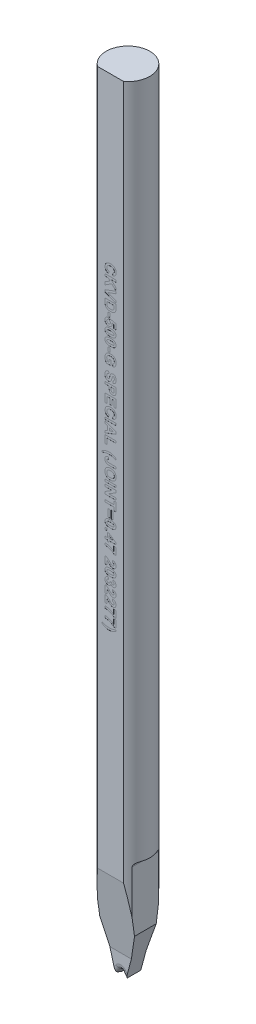
from build123d import *

# Parameters (mm, degrees)
SKETCH_TL_CUTTING_R       = 1.99771
TL_CUTTING_DEPTH          = 72.009
SKETCH_TDF_GRINDING_W     = 4.01542
SKETCH_TDF_GRINDING_H     = 4.01542
TDF_GRINDING_DEPTH        = 73.064400167
SKETCH_ENGRAVING_W        = 0.166666667
SKETCH_ENGRAVING_H        = 0.371794872
SKETCH_ENGRAVING_W_2      = 1
SKETCH_ENGRAVING_H_2      = 0.192307693
SKETCH_ENGRAVING_H_3      = 0.692307692
SKETCH_ENGRAVING_W_3      = 0.192307692
SKETCH_ENGRAVING_H_4      = 0.192307692
ENGRAVING_DEPTH           = 0.005
VW_VR_GRINDING_DEPTH      = 2.00771
VW_VR_GRINDING_DEPTH_BACK = 2.00771
ISA_GRINDING_DEPTH        = 2.00771
ISA_GRINDING_DEPTH_BACK   = 2.00771
PRE_FRX_BRX_DEPTH         = 2.00771
PRE_FRX_BRX_DEPTH_BACK    = 2.00771
SKETCH_PRE_FRX_BRX_W      = 1.33334
SKETCH_PRE_FRX_BRX_H      = 1.80086
FR_EDM_R                  = 0.50038
BR_EDM_R                  = 0.24892
FA_BA_GRINDING_DEPTH      = 2.00771
FA_BA_GRINDING_DEPTH_BACK = 2.00771


with BuildPart() as part:
    # sketch_TL_cutting → TL_cutting (new body)
    with BuildSketch(Plane(origin=(0, 0, 0), x_dir=(1, 0, 0), z_dir=(0, 1, 0))):
        Circle(SKETCH_TL_CUTTING_R)
    extrude(amount=TL_CUTTING_DEPTH)

    # sketch_TDF_grinding → TDF_grinding (cut, through all)
    with BuildSketch(Plane(origin=(0, 0, 0), x_dir=(1, 0, 0), z_dir=(0, 1, 0))):
        with Locations((0, -3.60918)):
            Rectangle(SKETCH_TDF_GRINDING_W, SKETCH_TDF_GRINDING_H)
    extrude(amount=TDF_GRINDING_DEPTH, mode=Mode.SUBTRACT)

    # sketch_engraving → engraving (cut)
    # profile 1 of 37: a face of its own
    with BuildSketch(Plane.XY.offset(1.60147)):
        with BuildLine():
            Line((-0.128205128, 56.265410256), (-0.192307692, 56.073102564))
            add(Edge.make_bspline(
                [(-0.192307692, 56.073102564), (-0.204917923, 56.077009052), (-0.229612721, 56.084659184), (-0.2649877, 56.098737804), (-0.297871332, 56.114732008), (-0.328259475, 56.132559875), (-0.356049464, 56.152295258), (-0.381471598, 56.173789244), (-0.404368127, 56.197253424), (-0.424673345, 56.222670624), (-0.442633936, 56.249763711), (-0.457816548, 56.278856053), (-0.470893242, 56.30951117), (-0.481488041, 56.342040557), (-0.489972889, 56.376228151), (-0.495577171, 56.412234413), (-0.499377062, 56.449890896), (-0.499789062, 56.475603283), (-0.5, 56.488767628)],
                knots=[0, 0, 0, 0, 1.126670901, 2.206376047, 3.246533763, 4.245677351, 5.210506282, 6.152793389, 7.083980095, 8.004497442, 8.926231833, 9.854395169, 10.801995143, 11.768203916, 12.771938831, 13.805609698, 14.87650608, 16, 16, 16, 16], degree=3))
            add(Edge.make_bspline(
                [(-0.5, 56.488767628), (-0.499663994, 56.505016309), (-0.499003061, 56.536977949), (-0.492350465, 56.583719052), (-0.481969511, 56.628260328), (-0.467601869, 56.670669613), (-0.448555271, 56.710648786), (-0.42571373, 56.748573108), (-0.398318662, 56.784009391), (-0.367249987, 56.817150716), (-0.332452821, 56.847279196), (-0.294134751, 56.873272297), (-0.253074131, 56.895810491), (-0.208709772, 56.913736594), (-0.161353037, 56.927821791), (-0.110975156, 56.937668328), (-0.057578507, 56.943834942), (-0.020984357, 56.944537083), (-0.002203526, 56.944897436)],
                knots=[0, 0, 0, 0, 1.025134988, 2.016471176, 2.973446247, 3.909197306, 4.836872559, 5.763618465, 6.698581235, 7.658772073, 8.627106982, 9.597494692, 10.576422683, 11.578339294, 12.6118974, 13.690673505, 14.814808564, 16, 16, 16, 16], degree=3))
            add(Edge.make_bspline(
                [(-0.002203526, 56.944897436), (0.017576475, 56.9445292), (0.056163648, 56.943810839), (0.112313555, 56.937762878), (0.165084042, 56.927716768), (0.214577853, 56.914140058), (0.260470573, 56.895929249), (0.303160692, 56.874073909), (0.342311169, 56.847956152), (0.377833814, 56.818031091), (0.409480853, 56.784897852), (0.437377469, 56.749193428), (0.460593243, 56.710691041), (0.479896446, 56.669867336), (0.494630503, 56.626423397), (0.505304611, 56.580476602), (0.511505561, 56.532006054), (0.512376199, 56.49886808), (0.512820513, 56.481956731)],
                knots=[0, 0, 0, 0, 1.212773307, 2.365899439, 3.458117515, 4.504331001, 5.50806732, 6.480562534, 7.440239902, 8.387651817, 9.323121479, 10.245404239, 11.160468186, 12.07454208, 13.009500751, 13.96802424, 14.963018902, 16, 16, 16, 16], degree=3))
            add(Edge.make_bspline(
                [(0.512820513, 56.481956731), (0.512448361, 56.467187276), (0.511718707, 56.438229796), (0.506761415, 56.395824506), (0.498061698, 56.355636158), (0.486319015, 56.317447521), (0.470821797, 56.281475987), (0.451884357, 56.247657111), (0.429606892, 56.215874651), (0.412205553, 56.196725065), (0.403445513, 56.187084936)],
                knots=[0, 0, 0, 0, 1.098510076, 2.153775193, 3.169777012, 4.153122333, 5.120892526, 6.076995459, 7.031936742, 8, 8, 8, 8], degree=3))
            add(Edge.make_bspline(
                [(0.403445513, 56.187084936), (0.39787141, 56.181497644), (0.386592274, 56.170191818), (0.367549896, 56.155095368), (0.347050772, 56.140782058), (0.324745215, 56.127479068), (0.30046466, 56.115606849), (0.274581981, 56.104594097), (0.246997406, 56.094455069), (0.227800247, 56.088816604), (0.217948718, 56.085923077)],
                knots=[0, 0, 0, 0, 0.885292881, 1.791380647, 2.722937556, 3.69093542, 4.703306561, 5.754477758, 6.847650944, 8, 8, 8, 8], degree=3))
            Line((0.217948718, 56.085923077), (0.179487179, 56.278230769))
            add(Edge.make_bspline(
                [(0.179487179, 56.278230769), (0.1857949, 56.279865288), (0.198219456, 56.283084861), (0.21607256, 56.28959955), (0.233014714, 56.297071208), (0.248625569, 56.3063361), (0.263619506, 56.316162074), (0.277222328, 56.327824773), (0.290109132, 56.340329754), (0.301694454, 56.354218861), (0.312145605, 56.369093589), (0.321339918, 56.384803983), (0.329014435, 56.401388478), (0.335156827, 56.418721754), (0.340319842, 56.436745702), (0.34350638, 56.455632147), (0.345953545, 56.475215752), (0.3460861, 56.488558875), (0.346153846, 56.495378205)],
                knots=[0, 0, 0, 0, 1.051114734, 2.070420253, 3.064047898, 4.034553068, 4.997066449, 5.953344811, 6.921213386, 7.892675544, 8.867420182, 9.852654213, 10.826683617, 11.811917648, 12.818610352, 13.848120519, 14.900229319, 16, 16, 16, 16], degree=3))
            add(Edge.make_bspline(
                [(0.346153846, 56.495378205), (0.345958725, 56.504742256), (0.345576529, 56.52308423), (0.341532101, 56.54981448), (0.335695112, 56.575255692), (0.326982094, 56.59931706), (0.315677399, 56.621931698), (0.302244603, 56.643428905), (0.286035184, 56.663260806), (0.26758257, 56.681899764), (0.246135655, 56.698607721), (0.221779967, 56.713310652), (0.194212535, 56.725504121), (0.163711493, 56.735404409), (0.130202077, 56.743196736), (0.093641969, 56.748761162), (0.054005962, 56.751838434), (0.026581025, 56.752333903), (0.012419872, 56.752589744)],
                knots=[0, 0, 0, 0, 0.93816214, 1.837638998, 2.704791736, 3.551915875, 4.396257554, 5.235807848, 6.087970119, 6.959042444, 7.860386085, 8.80649345, 9.804409709, 10.875695391, 12.017327537, 13.250155505, 14.580089023, 16, 16, 16, 16], degree=3))
            add(Edge.make_bspline(
                [(0.012419872, 56.752589744), (-0.002609028, 56.752336423), (-0.031567402, 56.751848312), (-0.073337178, 56.748771685), (-0.111754322, 56.743171705), (-0.14688701, 56.735482849), (-0.178713725, 56.725532973), (-0.207179389, 56.713359106), (-0.23231734, 56.698886701), (-0.254110839, 56.682138275), (-0.272831387, 56.663537256), (-0.288926796, 56.643587439), (-0.302688307, 56.622406524), (-0.314010391, 56.599867053), (-0.322575422, 56.575883298), (-0.328786932, 56.550652371), (-0.332735688, 56.524081695), (-0.333131326, 56.505875799), (-0.333333333, 56.496580128)],
                knots=[0, 0, 0, 0, 1.475208372, 2.842499301, 4.107722225, 5.282836115, 6.369007568, 7.375918121, 8.315702116, 9.208439171, 10.065831443, 10.90006451, 11.71996243, 12.54067204, 13.369972975, 14.214060185, 15.088124569, 16, 16, 16, 16], degree=3))
            add(Edge.make_bspline(
                [(-0.333333333, 56.496580128), (-0.333161634, 56.489697953), (-0.332824013, 56.476165176), (-0.330681155, 56.456162689), (-0.326591822, 56.43696438), (-0.321184418, 56.418476281), (-0.314399721, 56.400626559), (-0.305696319, 56.38368748), (-0.295693052, 56.367325777), (-0.283969989, 56.35188094), (-0.270808612, 56.337146156), (-0.255597341, 56.323707159), (-0.238701667, 56.311241373), (-0.220008678, 56.299906947), (-0.199678377, 56.28932516), (-0.177394008, 56.280322121), (-0.153515697, 56.271934984), (-0.136789345, 56.267623153), (-0.128205128, 56.265410256)],
                knots=[0, 0, 0, 0, 0.980177776, 1.927374078, 2.859849964, 3.771585772, 4.668674471, 5.574490016, 6.479656464, 7.396337719, 8.332153134, 9.288470092, 10.28125149, 11.318486971, 12.398724812, 13.541284404, 14.738150009, 16, 16, 16, 16], degree=3))
        make_face()
    # profile 2 of 37: a face of its own
    with BuildSketch(Plane.XY.offset(1.60147)):
        Polygon((-0.5, 55.906435897), (0.5, 55.906435897), (0.5, 55.714128205), (0.052283654, 55.714128205), (0.5, 55.292453526), (0.5, 55.028230769), (0.11338141, 55.408038462), (-0.5, 55.015410256), (-0.5, 55.271620192), (-0.035456731, 55.553871795), (-0.198517628, 55.714128205), (-0.5, 55.714128205), align=None)
    # profile 3 of 37: a face of its own
    with BuildSketch(Plane.XY.offset(1.60147)):
        Polygon((-0.5, 54.639208333), (0.5, 55.009), (0.5, 54.805875), (-0.243589744, 54.541051282), (0.5, 54.277229167), (0.5, 54.073102564), (-0.5, 54.441491987), align=None)
    # profile 4 of 37: a face of its own
    with BuildSketch(Plane.XY.offset(1.60147)):
        with BuildLine():
            Line((0.5, 53.983358974), (0.5, 53.616572115))
            add(Edge.make_bspline(
                [(0.5, 53.616572115), (0.500005193, 53.606554571), (0.500015306, 53.587048084), (0.498840892, 53.558739066), (0.497659587, 53.532266494), (0.495294873, 53.507706352), (0.492816233, 53.484973432), (0.489678088, 53.464026942), (0.485656212, 53.444999202), (0.482484481, 53.433000319), (0.480969551, 53.427269231)],
                knots=[0, 0, 0, 0, 1.259756885, 2.453039283, 3.563158368, 4.591894114, 5.55549294, 6.43918076, 7.254497783, 8, 8, 8, 8], degree=3))
            add(Edge.make_bspline(
                [(0.480969551, 53.427269231), (0.478637325, 53.420100254), (0.474014881, 53.405891431), (0.465827813, 53.385038378), (0.455960096, 53.365204479), (0.445111978, 53.345929819), (0.432903728, 53.327657553), (0.419595761, 53.309942873), (0.404753223, 53.293309803), (0.383633179, 53.27177514), (0.35420815, 53.247350255), (0.315375005, 53.22151972), (0.272594656, 53.199782014), (0.234409605, 53.184590641), (0.20183843, 53.174546542), (0.175754603, 53.167978141), (0.148301213, 53.162306468), (0.119383738, 53.158056292), (0.08913491, 53.154394906), (0.057465542, 53.151767238), (0.024383276, 53.15046625), (0.001870575, 53.150174494), (-0.009615385, 53.150025641)],
                knots=[0, 0, 0, 0, 0.745431882, 1.477436776, 2.212739876, 2.934276521, 3.663147754, 4.384200836, 5.123377481, 5.865761747, 7.365547505, 8.894711587, 10.468722596, 12.101948761, 12.951987285, 13.837595333, 14.760899389, 15.722756883, 16.726861385, 17.773652936, 18.864119771, 20, 20, 20, 20], degree=3))
            add(Edge.make_bspline(
                [(-0.009615385, 53.150025641), (-0.0294616, 53.150417046), (-0.067834928, 53.15117384), (-0.123301552, 53.156771211), (-0.17465514, 53.166066648), (-0.206804138, 53.175777075), (-0.222355769, 53.180474359)],
                knots=[0, 0, 0, 0, 1.103491527, 2.133638164, 3.0971734, 4, 4, 4, 4], degree=3))
            add(Edge.make_bspline(
                [(-0.222355769, 53.180474359), (-0.231274521, 53.183648003), (-0.248819098, 53.189891057), (-0.274127236, 53.200815932), (-0.298211673, 53.212620337), (-0.321053432, 53.225402184), (-0.342549771, 53.239226052), (-0.362636394, 53.254143645), (-0.381577746, 53.269923731), (-0.393236239, 53.28135549), (-0.399038462, 53.287044872)],
                knots=[0, 0, 0, 0, 1.090884612, 2.145940218, 3.175104604, 4.181306866, 5.161203701, 6.118658341, 7.063689906, 8, 8, 8, 8], degree=3))
            add(Edge.make_bspline(
                [(-0.399038462, 53.287044872), (-0.407300305, 53.296331145), (-0.424264154, 53.315398431), (-0.445652736, 53.34874995), (-0.464086504, 53.386625276), (-0.473760833, 53.413939168), (-0.478766026, 53.428070513)],
                knots=[0, 0, 0, 0, 0.912008655, 1.872605891, 2.89935344, 4, 4, 4, 4], degree=3))
            add(Edge.make_bspline(
                [(-0.478766026, 53.428070513), (-0.4805228, 53.433790486), (-0.484168894, 53.445661996), (-0.488062998, 53.464485444), (-0.492165475, 53.484579947), (-0.49463687, 53.506177223), (-0.497243066, 53.529053081), (-0.498706299, 53.553389822), (-0.49974511, 53.579103081), (-0.499913777, 53.596739175), (-0.5, 53.605754808)],
                knots=[0, 0, 0, 0, 0.799129865, 1.658552685, 2.566799617, 3.538529252, 4.561352959, 5.643373779, 6.795284424, 8, 8, 8, 8], degree=3))
            Line((-0.5, 53.605754808), (-0.5, 53.983358974))
            Line((-0.5, 53.983358974), (0.5, 53.983358974))
        make_face()
        with BuildLine():
            Line((0.333333333, 53.791051282), (-0.333333333, 53.791051282))
            Line((-0.333333333, 53.791051282), (-0.333333333, 53.632798077))
            add(Edge.make_bspline(
                [(-0.333333333, 53.632798077), (-0.333276671, 53.62565336), (-0.333167574, 53.611897049), (-0.332847006, 53.591991316), (-0.331979167, 53.573698115), (-0.331080228, 53.556921614), (-0.329595022, 53.54170549), (-0.328134266, 53.527983535), (-0.326090699, 53.515832132), (-0.324477534, 53.508327127), (-0.323717949, 53.504793269)],
                knots=[0, 0, 0, 0, 1.333384787, 2.567275092, 3.714769766, 4.750907381, 5.701951617, 6.567520054, 7.325492842, 8, 8, 8, 8], degree=3))
            add(Edge.make_bspline(
                [(-0.323717949, 53.504793269), (-0.321509316, 53.496516575), (-0.317207482, 53.480395757), (-0.307617456, 53.457760499), (-0.296048139, 53.437278507), (-0.282136533, 53.41860677), (-0.26455548, 53.40177967), (-0.242070693, 53.387415683), (-0.215254411, 53.374122192), (-0.189584523, 53.365018806), (-0.16665678, 53.358484413), (-0.147412959, 53.354061165), (-0.126593091, 53.350565591), (-0.104279343, 53.347558942), (-0.080500412, 53.345129499), (-0.055170426, 53.343617784), (-0.028320392, 53.342586029), (-0.009883527, 53.342419161), (-0.000400641, 53.342333333)],
                knots=[0, 0, 0, 0, 1.038686998, 2.023088296, 2.974059649, 3.888265163, 4.839857954, 5.909819677, 7.113156087, 8.466843969, 9.20827164, 10.006482943, 10.861893492, 11.769681931, 12.739021491, 13.762258324, 14.849031541, 16, 16, 16, 16], degree=3))
            add(Edge.make_bspline(
                [(-0.000400641, 53.342333333), (0.009082275, 53.3424185), (0.027452469, 53.342583485), (0.054102292, 53.343613664), (0.079033415, 53.345116863), (0.102276578, 53.347563691), (0.123864169, 53.350523456), (0.143813574, 53.354060891), (0.161996804, 53.358454423), (0.183589283, 53.365007511), (0.207947697, 53.374844996), (0.23429421, 53.388671199), (0.2571147, 53.404936402), (0.276689574, 53.423291558), (0.29287817, 53.444378569), (0.306422028, 53.467749371), (0.316938162, 53.493880279), (0.321416742, 53.512469318), (0.323717949, 53.522020833)],
                knots=[0, 0, 0, 0, 1.118059345, 2.165891593, 3.144157881, 4.062285166, 4.920717571, 5.712910489, 6.449981617, 7.12489426, 8.371943983, 9.541298068, 10.624898781, 11.666293176, 12.69306237, 13.747704633, 14.842713931, 16, 16, 16, 16], degree=3))
            add(Edge.make_bspline(
                [(0.323717949, 53.522020833), (0.324486218, 53.526155143), (0.326177652, 53.535257311), (0.328151987, 53.550361571), (0.329628909, 53.568148179), (0.331099472, 53.588577116), (0.331977905, 53.611627064), (0.332859431, 53.637332571), (0.333166326, 53.665716851), (0.333276065, 53.685549207), (0.333333333, 53.695899038)],
                knots=[0, 0, 0, 0, 0.578739524, 1.274162912, 2.095457587, 3.035141998, 4.093102578, 5.270121571, 6.575369351, 8, 8, 8, 8], degree=3))
            Line((0.333333333, 53.695899038), (0.333333333, 53.791051282))
        make_face(mode=Mode.SUBTRACT)
    # profile 5 of 37: a face of its own
    with BuildSketch(Plane.XY.offset(1.60147)):
        with Locations((-0.147435898, 52.823102564)):
            Rectangle(SKETCH_ENGRAVING_W, SKETCH_ENGRAVING_H)
    # profile 6 of 37: a face of its own
    with BuildSketch(Plane.XY.offset(1.60147)):
        with BuildLine():
            Line((-0.213942308, 52.573102564), (-0.192307692, 52.406435897))
            add(Edge.make_bspline(
                [(-0.192307692, 52.406435897), (-0.203607347, 52.404586826), (-0.225366694, 52.401026133), (-0.255826929, 52.390063828), (-0.282470914, 52.374435917), (-0.305088238, 52.354761759), (-0.323334969, 52.332318846), (-0.336523954, 52.307649962), (-0.344692684, 52.281280099), (-0.34566455, 52.262996649), (-0.346153846, 52.253791667)],
                knots=[0, 0, 0, 0, 1.155217688, 2.224562036, 3.249849536, 4.259092678, 5.238040954, 6.15568152, 7.071459712, 8, 8, 8, 8], degree=3))
            add(Edge.make_bspline(
                [(-0.346153846, 52.253791667), (-0.346059894, 52.248443112), (-0.34587598, 52.237973234), (-0.34378776, 52.222544535), (-0.340396301, 52.20780521), (-0.335789422, 52.193618977), (-0.329745146, 52.180121981), (-0.322266898, 52.16729854), (-0.313608966, 52.15499075), (-0.303697677, 52.143355274), (-0.29215854, 52.13291258), (-0.27939506, 52.123638023), (-0.265101057, 52.116050338), (-0.249674797, 52.109508976), (-0.232663378, 52.104881315), (-0.214481969, 52.101169692), (-0.194883734, 52.099284068), (-0.18142672, 52.098927617), (-0.174479167, 52.09874359)],
                knots=[0, 0, 0, 0, 0.98109136, 1.920501424, 2.850996269, 3.75396817, 4.653607445, 5.559568228, 6.474190795, 7.412641135, 8.358186253, 9.324081521, 10.300185094, 11.322066343, 12.392681767, 13.529496655, 14.72453472, 16, 16, 16, 16], degree=3))
            add(Edge.make_bspline(
                [(-0.174479167, 52.09874359), (-0.167930185, 52.098847549), (-0.155273198, 52.099048469), (-0.136935362, 52.10091253), (-0.119798482, 52.103773852), (-0.103987864, 52.108325768), (-0.089209555, 52.113524403), (-0.075987454, 52.120533513), (-0.063746794, 52.128224163), (-0.053149329, 52.13759838), (-0.04378212, 52.147810732), (-0.035449479, 52.158693065), (-0.028416647, 52.170390594), (-0.022600846, 52.18279263), (-0.018105451, 52.195952809), (-0.015265585, 52.209899831), (-0.013079926, 52.224477064), (-0.012907894, 52.234485328), (-0.012820513, 52.23956891)],
                knots=[0, 0, 0, 0, 1.292262537, 2.497510385, 3.635136149, 4.715991128, 5.741845981, 6.720379908, 7.663568786, 8.58853187, 9.502632107, 10.396263742, 11.289117461, 12.191261909, 13.095714127, 14.026387781, 14.997526353, 16, 16, 16, 16], degree=3))
            add(Edge.make_bspline(
                [(-0.012820513, 52.23956891), (-0.013050924, 52.245995741), (-0.013510598, 52.25881737), (-0.017247301, 52.277744398), (-0.02333068, 52.29616685), (-0.031799166, 52.314065577), (-0.042720432, 52.331393226), (-0.056130694, 52.348074776), (-0.071799231, 52.364396575), (-0.083638008, 52.374422371), (-0.08974359, 52.379592949)],
                knots=[0, 0, 0, 0, 0.931687088, 1.85873035, 2.786835662, 3.740075265, 4.723687035, 5.750832598, 6.840042753, 8, 8, 8, 8], degree=3))
            Line((-0.08974359, 52.379592949), (-0.066105769, 52.547461538))
            Line((-0.066105769, 52.547461538), (0.487179487, 52.432076923))
            Line((0.487179487, 52.432076923), (0.487179487, 51.944897436))
            Line((0.487179487, 51.944897436), (0.294871795, 51.944897436))
            Line((0.294871795, 51.944897436), (0.294871795, 52.277830128))
            Line((0.294871795, 52.277830128), (0.116386218, 52.317092949))
            add(Edge.make_bspline(
                [(0.116386218, 52.317092949), (0.122158957, 52.307087656), (0.133400829, 52.287603282), (0.144973305, 52.25649635), (0.152400706, 52.225229621), (0.153366831, 52.204152487), (0.153846154, 52.193695513)],
                knots=[0, 0, 0, 0, 1.060051984, 2.064352337, 3.039669322, 4, 4, 4, 4], degree=3))
            add(Edge.make_bspline(
                [(0.153846154, 52.193695513), (0.153581613, 52.183865068), (0.153059042, 52.164446132), (0.148771515, 52.135966641), (0.141705229, 52.108649395), (0.131871753, 52.08240215), (0.118982632, 52.057412644), (0.103404168, 52.033465451), (0.084866032, 52.010906296), (0.063903438, 51.989492789), (0.04071085, 51.969965174), (0.015420507, 51.953101525), (-0.011337699, 51.938536215), (-0.039859413, 51.926678326), (-0.070184315, 51.917748996), (-0.102051282, 51.91106179), (-0.135661543, 51.907315665), (-0.158578281, 51.906733149), (-0.170272436, 51.906435897)],
                knots=[0, 0, 0, 0, 0.974409932, 1.924837087, 2.848242317, 3.768103797, 4.697919751, 5.630842317, 6.595644344, 7.588240789, 8.59876155, 9.595918743, 10.597287627, 11.615415169, 12.652315553, 13.727511434, 14.840374562, 16, 16, 16, 16], degree=3))
            add(Edge.make_bspline(
                [(-0.170272436, 51.906435897), (-0.180095164, 51.90670219), (-0.199591316, 51.907230727), (-0.228431015, 51.910374662), (-0.256480502, 51.916084756), (-0.283660862, 51.923892183), (-0.310181667, 51.93373598), (-0.335760069, 51.945979792), (-0.360613268, 51.960472719), (-0.376286294, 51.971679985), (-0.384214744, 51.977349359)],
                knots=[0, 0, 0, 0, 1.0275977, 2.039576086, 3.029943557, 4.018141221, 4.995043124, 5.985410594, 6.980887897, 8, 8, 8, 8], degree=3))
            add(Edge.make_bspline(
                [(-0.384214744, 51.977349359), (-0.39442561, 51.985610871), (-0.414521783, 52.001870487), (-0.440928765, 52.029712796), (-0.463196136, 52.060010934), (-0.481238657, 52.092734524), (-0.495700415, 52.127611763), (-0.505577236, 52.165007561), (-0.511741284, 52.20464131), (-0.51245553, 52.231866597), (-0.512820513, 52.245778846)],
                knots=[0, 0, 0, 0, 1.018155984, 2.003849412, 2.967446846, 3.927472908, 4.896208823, 5.888955604, 6.921246412, 8, 8, 8, 8], degree=3))
            add(Edge.make_bspline(
                [(-0.512820513, 52.245778846), (-0.51261689, 52.257007919), (-0.512219305, 52.278933296), (-0.508313832, 52.311046963), (-0.50189785, 52.341525845), (-0.493201931, 52.370514952), (-0.481586571, 52.397739005), (-0.467806969, 52.423532218), (-0.451267563, 52.447697806), (-0.432181131, 52.470093624), (-0.411081442, 52.490657914), (-0.387995531, 52.509000686), (-0.363308362, 52.52532086), (-0.336770788, 52.539307199), (-0.308568836, 52.551226858), (-0.278557994, 52.560717794), (-0.246938394, 52.568532152), (-0.225062746, 52.57156223), (-0.213942308, 52.573102564)],
                knots=[0, 0, 0, 0, 1.098896741, 2.145655864, 3.16104256, 4.145315902, 5.10323158, 6.053780891, 7.003858069, 7.963890296, 8.930045353, 9.883557002, 10.846278307, 11.82296847, 12.816080213, 13.83936887, 14.901647787, 16, 16, 16, 16], degree=3))
        make_face()
    # profile 7 of 37: a face of its own
    with BuildSketch(Plane.XY.offset(1.60147)):
        with BuildLine():
            add(Edge.make_bspline(
                [(0.5, 51.476948718), (0.49971384, 51.465044998), (0.499156721, 51.441869821), (0.494192381, 51.408107508), (0.486315205, 51.376354925), (0.474936732, 51.346605943), (0.460535804, 51.318709267), (0.442472771, 51.293057415), (0.421624591, 51.26905643), (0.405435577, 51.255200797), (0.397235577, 51.248182692)],
                knots=[0, 0, 0, 0, 1.098626248, 2.138899374, 3.143835643, 4.113754749, 5.073488057, 6.034745239, 7.004566348, 8, 8, 8, 8], degree=3))
            add(Edge.make_bspline(
                [(0.397235577, 51.248182692), (0.392013767, 51.244167993), (0.381356969, 51.235974695), (0.364136726, 51.22494029), (0.345869985, 51.214331685), (0.326116385, 51.205073442), (0.305221356, 51.196200078), (0.283126793, 51.188009313), (0.259707844, 51.18077695), (0.235071142, 51.174472124), (0.209179241, 51.168578627), (0.181968999, 51.163641398), (0.15350924, 51.159415972), (0.123831018, 51.156120738), (0.092992495, 51.153166339), (0.060842825, 51.151549757), (0.027454838, 51.150225267), (0.004742429, 51.150092949), (-0.006810897, 51.150025641)],
                knots=[0, 0, 0, 0, 0.746775751, 1.524038446, 2.317840886, 3.141016509, 3.996283186, 4.892488336, 5.812382473, 6.774967264, 7.776368117, 8.823659909, 9.910833035, 11.039122168, 12.210293276, 13.424012874, 14.68964937, 16, 16, 16, 16], degree=3))
            add(Edge.make_bspline(
                [(-0.006810897, 51.150025641), (-0.01836425, 51.150091934), (-0.041009977, 51.150221876), (-0.074330982, 51.151554693), (-0.106413621, 51.153167781), (-0.13725379, 51.156113853), (-0.166926114, 51.159440728), (-0.195353975, 51.163546272), (-0.22243919, 51.168864764), (-0.248289812, 51.174671418), (-0.27303117, 51.180936077), (-0.296407841, 51.1884899), (-0.318777777, 51.196350303), (-0.339699687, 51.205429898), (-0.359477735, 51.215020372), (-0.377930928, 51.225471112), (-0.395257891, 51.236628726), (-0.40597091, 51.244901289), (-0.411258013, 51.248983974)],
                knots=[0, 0, 0, 0, 1.308411734, 2.564617834, 3.776541518, 4.94597967, 6.0725993, 7.15816376, 8.197872509, 9.197791611, 10.158952087, 11.086962723, 11.979249638, 12.843171697, 13.668427753, 14.467630577, 15.243743175, 16, 16, 16, 16], degree=3))
            add(Edge.make_bspline(
                [(-0.411258013, 51.248983974), (-0.419387722, 51.255937875), (-0.435436162, 51.269665209), (-0.456111536, 51.293400465), (-0.473801555, 51.3190109), (-0.487914093, 51.346857064), (-0.499368982, 51.376461236), (-0.506993451, 51.408265546), (-0.511967929, 51.441935616), (-0.512532265, 51.465111213), (-0.512820513, 51.476948718)],
                knots=[0, 0, 0, 0, 0.991667276, 1.957599061, 2.911530233, 3.873218945, 4.847995157, 5.850445929, 6.902062539, 8, 8, 8, 8], degree=3))
            add(Edge.make_bspline(
                [(-0.512820513, 51.476948718), (-0.512476011, 51.488921133), (-0.511800941, 51.512381702), (-0.506449472, 51.546635149), (-0.497876451, 51.579194622), (-0.485636462, 51.609943234), (-0.469774335, 51.638836989), (-0.45076002, 51.666101616), (-0.427732542, 51.691143948), (-0.40629523, 51.710749361), (-0.386925042, 51.725092741), (-0.37086259, 51.735209036), (-0.353675124, 51.744985358), (-0.33482528, 51.753423499), (-0.314870578, 51.761748475), (-0.293380967, 51.769121787), (-0.270541238, 51.775626959), (-0.246455682, 51.781734901), (-0.220958398, 51.786828025), (-0.194124629, 51.791512952), (-0.165840258, 51.795204927), (-0.136262825, 51.798478243), (-0.105322509, 51.800782844), (-0.073069943, 51.802654475), (-0.039401887, 51.803592969), (-0.01649349, 51.803777608), (-0.004807692, 51.803871795)],
                knots=[0, 0, 0, 0, 1.257818097, 2.464759732, 3.634271214, 4.790227596, 5.933394726, 7.09190477, 8.274482889, 9.50191983, 10.139172818, 10.805000628, 11.49619854, 12.215266328, 12.973768034, 13.768328009, 14.601232062, 15.469317089, 16.379095881, 17.333267023, 18.331755967, 19.376479622, 20.460535752, 21.592206075, 22.771760786, 24, 24, 24, 24], degree=3))
            add(Edge.make_bspline(
                [(-0.004807692, 51.803871795), (0.006678925, 51.803806), (0.02919122, 51.803677052), (0.062378132, 51.802334948), (0.094328674, 51.800741634), (0.12509981, 51.79776902), (0.154640959, 51.794469515), (0.183004063, 51.790356894), (0.209982531, 51.784938814), (0.235876189, 51.779589743), (0.260431507, 51.772849782), (0.2837906, 51.765424475), (0.306110518, 51.757590136), (0.326924245, 51.748417854), (0.346659803, 51.738882898), (0.365109758, 51.728424838), (0.382437536, 51.717269066), (0.39315045, 51.708996265), (0.3984375, 51.704913462)],
                knots=[0, 0, 0, 0, 1.304443357, 2.556541329, 3.771813033, 4.936929721, 6.066661712, 7.147723817, 8.190304831, 9.191350322, 10.149780912, 11.080355239, 11.975107155, 12.834450748, 13.66198663, 14.463397305, 15.241653965, 16, 16, 16, 16], degree=3))
            add(Edge.make_bspline(
                [(0.3984375, 51.704913462), (0.406566428, 51.697959179), (0.422613323, 51.684231089), (0.443299998, 51.660501361), (0.460913987, 51.634919209), (0.475197493, 51.607154301), (0.486497465, 51.577482107), (0.494183265, 51.545636121), (0.499144648, 51.511960686), (0.499710816, 51.488785839), (0.5, 51.476948718)],
                knots=[0, 0, 0, 0, 0.991631672, 1.957528776, 2.911425699, 3.867574088, 4.848108326, 5.850523106, 6.902101959, 8, 8, 8, 8], degree=3))
        make_face()
        with BuildLine():
            add(Edge.make_bspline(
                [(0.333333333, 51.476948718), (0.333068079, 51.483116684), (0.332548986, 51.495187158), (0.328316127, 51.512742094), (0.321759633, 51.529323165), (0.312130705, 51.544881206), (0.299093083, 51.55928978), (0.281476094, 51.571497658), (0.259881539, 51.582051162), (0.243736, 51.587330771), (0.235176282, 51.590129808)],
                knots=[0, 0, 0, 0, 0.909107913, 1.77908945, 2.650019014, 3.530482969, 4.465025013, 5.495890128, 6.672421267, 8, 8, 8, 8], degree=3))
            add(Edge.make_bspline(
                [(0.235176282, 51.590129808), (0.228718042, 51.591877997), (0.214837576, 51.595635317), (0.192206647, 51.59989972), (0.166522939, 51.603416485), (0.137792419, 51.606386038), (0.105999886, 51.608802628), (0.071125109, 51.610290848), (0.033192525, 51.611319478), (0.006878451, 51.611480391), (-0.006810897, 51.611564103)],
                knots=[0, 0, 0, 0, 0.658986521, 1.416336438, 2.266694271, 3.212608458, 4.261595115, 5.407496572, 6.651304179, 8, 8, 8, 8], degree=3))
            add(Edge.make_bspline(
                [(-0.006810897, 51.611564103), (-0.020433943, 51.611573117), (-0.046549094, 51.611590397), (-0.084006477, 51.610416163), (-0.118154033, 51.60924872), (-0.148991056, 51.606879061), (-0.176626244, 51.604540892), (-0.200847568, 51.601003343), (-0.221857789, 51.597450608), (-0.244486895, 51.591417153), (-0.268257705, 51.583101394), (-0.292448985, 51.571872977), (-0.311537375, 51.559207058), (-0.325415776, 51.544675587), (-0.334597404, 51.528930329), (-0.341538269, 51.512626395), (-0.345246665, 51.495074555), (-0.345848983, 51.483040013), (-0.346153846, 51.476948718)],
                knots=[0, 0, 0, 0, 1.613038927, 3.092168624, 4.43749063, 5.658264602, 6.75425577, 7.720394221, 8.556328411, 9.275513998, 10.490872946, 11.534172084, 12.42681833, 13.187531851, 13.88996177, 14.574222125, 15.278341114, 16, 16, 16, 16], degree=3))
            add(Edge.make_bspline(
                [(-0.346153846, 51.476948718), (-0.345874419, 51.47085088), (-0.345321688, 51.458788799), (-0.341225408, 51.441256833), (-0.334465655, 51.424699336), (-0.325029126, 51.409036493), (-0.311901617, 51.39461441), (-0.294300445, 51.382397614), (-0.272700888, 51.37184693), (-0.25655611, 51.366566893), (-0.247996795, 51.363767628)],
                knots=[0, 0, 0, 0, 0.899391665, 1.779078861, 2.640979247, 3.529945348, 4.464599804, 5.495588918, 6.672261578, 8, 8, 8, 8], degree=3))
            add(Edge.make_bspline(
                [(-0.247996795, 51.363767628), (-0.241538043, 51.362021968), (-0.227719754, 51.358287186), (-0.205229709, 51.353992396), (-0.179679092, 51.35046611), (-0.151079269, 51.347524791), (-0.11935541, 51.345084431), (-0.084546407, 51.343608845), (-0.046680798, 51.342579247), (-0.020433482, 51.342417356), (-0.006810897, 51.342333333)],
                knots=[0, 0, 0, 0, 0.66114423, 1.414496391, 2.261103113, 3.210114492, 4.255954433, 5.405607896, 6.653488082, 8, 8, 8, 8], degree=3))
            add(Edge.make_bspline(
                [(-0.006810897, 51.342333333), (0.006810741, 51.342447109), (0.032921137, 51.342665199), (0.070464093, 51.343292091), (0.104645163, 51.345047006), (0.13553417, 51.346803226), (0.163028833, 51.349768631), (0.187277888, 51.352711537), (0.208178651, 51.356783667), (0.23096624, 51.362375697), (0.254848985, 51.37071368), (0.278913284, 51.38228584), (0.298191428, 51.39472291), (0.312146257, 51.409229879), (0.321683592, 51.424948044), (0.328364426, 51.441400374), (0.332523972, 51.458849531), (0.333060584, 51.47084941), (0.333333333, 51.476948718)],
                knots=[0, 0, 0, 0, 1.611458614, 3.088895909, 4.441089836, 5.660086535, 6.747875232, 7.711965119, 8.548505902, 9.26500436, 10.486583113, 11.532259092, 12.419544583, 13.184925779, 13.890764661, 14.581638641, 15.279074115, 16, 16, 16, 16], degree=3))
        make_face(mode=Mode.SUBTRACT)
    # profile 8 of 37: a face of its own
    with BuildSketch(Plane.XY.offset(1.60147)):
        with BuildLine():
            add(Edge.make_bspline(
                [(0.5, 50.707717949), (0.49971384, 50.695814229), (0.499156721, 50.672639051), (0.494192381, 50.638876739), (0.486315205, 50.607124156), (0.474936732, 50.577375173), (0.460535804, 50.549478497), (0.442472771, 50.523826646), (0.421624591, 50.499825661), (0.405435577, 50.485970028), (0.397235577, 50.478951923)],
                knots=[0, 0, 0, 0, 1.098626248, 2.138899374, 3.143835643, 4.113754749, 5.073488057, 6.034745239, 7.004566348, 8, 8, 8, 8], degree=3))
            add(Edge.make_bspline(
                [(0.397235577, 50.478951923), (0.392013767, 50.474937224), (0.381356969, 50.466743926), (0.364136726, 50.45570952), (0.345869985, 50.445100915), (0.326116385, 50.435842673), (0.305221356, 50.426969309), (0.283126793, 50.418778544), (0.259707844, 50.41154618), (0.235071142, 50.405241354), (0.209179241, 50.399347858), (0.181968999, 50.394410628), (0.15350924, 50.390185203), (0.123831018, 50.386889969), (0.092992495, 50.38393557), (0.060842825, 50.382318988), (0.027454838, 50.380994498), (0.004742429, 50.380862179), (-0.006810897, 50.380794872)],
                knots=[0, 0, 0, 0, 0.746775751, 1.524038446, 2.317840886, 3.141016509, 3.996283186, 4.892488336, 5.812382473, 6.774967264, 7.776368117, 8.823659909, 9.910833035, 11.039122168, 12.210293276, 13.424012874, 14.68964937, 16, 16, 16, 16], degree=3))
            add(Edge.make_bspline(
                [(-0.006810897, 50.380794872), (-0.01836425, 50.380861165), (-0.041009977, 50.380991107), (-0.074330982, 50.382323924), (-0.106413621, 50.383937012), (-0.13725379, 50.386883084), (-0.166926114, 50.390209959), (-0.195353975, 50.394315503), (-0.22243919, 50.399633995), (-0.248289812, 50.405440649), (-0.27303117, 50.411705308), (-0.296407841, 50.419259131), (-0.318777777, 50.427119533), (-0.339699687, 50.436199129), (-0.359477735, 50.445789602), (-0.377930928, 50.456240342), (-0.395257891, 50.467397957), (-0.40597091, 50.47567052), (-0.411258013, 50.479753205)],
                knots=[0, 0, 0, 0, 1.308411734, 2.564617834, 3.776541518, 4.94597967, 6.0725993, 7.15816376, 8.197872509, 9.197791611, 10.158952087, 11.086962723, 11.979249638, 12.843171697, 13.668427753, 14.467630577, 15.243743175, 16, 16, 16, 16], degree=3))
            add(Edge.make_bspline(
                [(-0.411258013, 50.479753205), (-0.419387722, 50.486707105), (-0.435436162, 50.50043444), (-0.456111536, 50.524169695), (-0.473801555, 50.549780131), (-0.487914093, 50.577626295), (-0.499368982, 50.607230467), (-0.506993451, 50.639034777), (-0.511967929, 50.672704847), (-0.512532265, 50.695880444), (-0.512820513, 50.707717949)],
                knots=[0, 0, 0, 0, 0.991667276, 1.957599061, 2.911530233, 3.873218945, 4.847995157, 5.850445929, 6.902062539, 8, 8, 8, 8], degree=3))
            add(Edge.make_bspline(
                [(-0.512820513, 50.707717949), (-0.512476011, 50.719690364), (-0.511800941, 50.743150933), (-0.506449472, 50.777404379), (-0.497876451, 50.809963853), (-0.485636462, 50.840712465), (-0.469774335, 50.86960622), (-0.45076002, 50.896870847), (-0.427732542, 50.921913179), (-0.40629523, 50.941518592), (-0.386925042, 50.955861971), (-0.37086259, 50.965978267), (-0.353675124, 50.975754589), (-0.33482528, 50.98419273), (-0.314870578, 50.992517706), (-0.293380967, 50.999891018), (-0.270541238, 51.00639619), (-0.246455682, 51.012504132), (-0.220958398, 51.017597256), (-0.194124629, 51.022282183), (-0.165840258, 51.025974157), (-0.136262825, 51.029247473), (-0.105322509, 51.031552075), (-0.073069943, 51.033423706), (-0.039401887, 51.0343622), (-0.01649349, 51.034546839), (-0.004807692, 51.034641026)],
                knots=[0, 0, 0, 0, 1.257818097, 2.464759732, 3.634271214, 4.790227596, 5.933394726, 7.09190477, 8.274482889, 9.50191983, 10.139172818, 10.805000628, 11.49619854, 12.215266328, 12.973768034, 13.768328009, 14.601232062, 15.469317089, 16.379095881, 17.333267023, 18.331755967, 19.376479622, 20.460535752, 21.592206075, 22.771760786, 24, 24, 24, 24], degree=3))
            add(Edge.make_bspline(
                [(-0.004807692, 51.034641026), (0.006678925, 51.034575231), (0.02919122, 51.034446282), (0.062378132, 51.033104179), (0.094328674, 51.031510865), (0.12509981, 51.028538251), (0.154640959, 51.025238746), (0.183004063, 51.021126125), (0.209982531, 51.015708045), (0.235876189, 51.010358974), (0.260431507, 51.003619013), (0.2837906, 50.996193706), (0.306110518, 50.988359367), (0.326924245, 50.979187084), (0.346659803, 50.969652128), (0.365109758, 50.959194069), (0.382437536, 50.948038297), (0.39315045, 50.939765495), (0.3984375, 50.935682692)],
                knots=[0, 0, 0, 0, 1.304443357, 2.556541329, 3.771813033, 4.936929721, 6.066661712, 7.147723817, 8.190304831, 9.191350322, 10.149780912, 11.080355239, 11.975107155, 12.834450748, 13.66198663, 14.463397305, 15.241653965, 16, 16, 16, 16], degree=3))
            add(Edge.make_bspline(
                [(0.3984375, 50.935682692), (0.406566428, 50.92872841), (0.422613323, 50.91500032), (0.443299998, 50.891270592), (0.460913987, 50.865688439), (0.475197493, 50.837923532), (0.486497465, 50.808251338), (0.494183265, 50.776405352), (0.499144648, 50.742729916), (0.499710816, 50.71955507), (0.5, 50.707717949)],
                knots=[0, 0, 0, 0, 0.991631672, 1.957528776, 2.911425699, 3.867574088, 4.848108326, 5.850523106, 6.902101959, 8, 8, 8, 8], degree=3))
        make_face()
        with BuildLine():
            add(Edge.make_bspline(
                [(0.333333333, 50.707717949), (0.333068079, 50.713885915), (0.332548986, 50.725956389), (0.328316127, 50.743511325), (0.321759633, 50.760092396), (0.312130705, 50.775650436), (0.299093083, 50.790059011), (0.281476094, 50.802266888), (0.259881539, 50.812820392), (0.243736, 50.818100001), (0.235176282, 50.820899038)],
                knots=[0, 0, 0, 0, 0.909107913, 1.77908945, 2.650019014, 3.530482969, 4.465025013, 5.495890128, 6.672421267, 8, 8, 8, 8], degree=3))
            add(Edge.make_bspline(
                [(0.235176282, 50.820899038), (0.228718042, 50.822647227), (0.214837576, 50.826404548), (0.192206647, 50.830668951), (0.166522939, 50.834185716), (0.137792419, 50.837155269), (0.105999886, 50.839571859), (0.071125109, 50.841060078), (0.033192525, 50.842088709), (0.006878451, 50.842249622), (-0.006810897, 50.842333333)],
                knots=[0, 0, 0, 0, 0.658986521, 1.416336438, 2.266694271, 3.212608458, 4.261595115, 5.407496572, 6.651304179, 8, 8, 8, 8], degree=3))
            add(Edge.make_bspline(
                [(-0.006810897, 50.842333333), (-0.020433943, 50.842342347), (-0.046549094, 50.842359627), (-0.084006477, 50.841185394), (-0.118154033, 50.840017951), (-0.148991056, 50.837648292), (-0.176626244, 50.835310123), (-0.200847568, 50.831772574), (-0.221857789, 50.828219839), (-0.244486895, 50.822186384), (-0.268257705, 50.813870625), (-0.292448985, 50.802642207), (-0.311537375, 50.789976289), (-0.325415776, 50.775444818), (-0.334597404, 50.75969956), (-0.341538269, 50.743395625), (-0.345246665, 50.725843786), (-0.345848983, 50.713809244), (-0.346153846, 50.707717949)],
                knots=[0, 0, 0, 0, 1.613038927, 3.092168624, 4.43749063, 5.658264602, 6.75425577, 7.720394221, 8.556328411, 9.275513998, 10.490872946, 11.534172084, 12.42681833, 13.187531851, 13.88996177, 14.574222125, 15.278341114, 16, 16, 16, 16], degree=3))
            add(Edge.make_bspline(
                [(-0.346153846, 50.707717949), (-0.345874419, 50.701620111), (-0.345321688, 50.68955803), (-0.341225408, 50.672026063), (-0.334465655, 50.655468567), (-0.325029126, 50.639805723), (-0.311901617, 50.625383641), (-0.294300445, 50.613166845), (-0.272700888, 50.602616161), (-0.25655611, 50.597336123), (-0.247996795, 50.594536859)],
                knots=[0, 0, 0, 0, 0.899391665, 1.779078861, 2.640979247, 3.529945348, 4.464599804, 5.495588918, 6.672261578, 8, 8, 8, 8], degree=3))
            add(Edge.make_bspline(
                [(-0.247996795, 50.594536859), (-0.241538043, 50.592791199), (-0.227719754, 50.589056417), (-0.205229709, 50.584761627), (-0.179679092, 50.58123534), (-0.151079269, 50.578294022), (-0.11935541, 50.575853662), (-0.084546407, 50.574378076), (-0.046680798, 50.573348478), (-0.020433482, 50.573186587), (-0.006810897, 50.573102564)],
                knots=[0, 0, 0, 0, 0.66114423, 1.414496391, 2.261103113, 3.210114492, 4.255954433, 5.405607896, 6.653488082, 8, 8, 8, 8], degree=3))
            add(Edge.make_bspline(
                [(-0.006810897, 50.573102564), (0.006810741, 50.57321634), (0.032921137, 50.57343443), (0.070464093, 50.574061322), (0.104645163, 50.575816237), (0.13553417, 50.577572457), (0.163028833, 50.580537861), (0.187277888, 50.583480768), (0.208178651, 50.587552897), (0.23096624, 50.593144928), (0.254848985, 50.60148291), (0.278913284, 50.613055071), (0.298191428, 50.625492141), (0.312146257, 50.63999911), (0.321683592, 50.655717274), (0.328364426, 50.672169605), (0.332523972, 50.689618762), (0.333060584, 50.701618641), (0.333333333, 50.707717949)],
                knots=[0, 0, 0, 0, 1.611458614, 3.088895909, 4.441089836, 5.660086535, 6.747875232, 7.711965119, 8.548505902, 9.26500436, 10.486583113, 11.532259092, 12.419544583, 13.184925779, 13.890764661, 14.581638641, 15.279074115, 16, 16, 16, 16], degree=3))
        make_face(mode=Mode.SUBTRACT)
    # profile 9 of 37: a face of its own
    with BuildSketch(Plane.XY.offset(1.60147)):
        with Locations((-0.147435898, 50.053871795)):
            Rectangle(SKETCH_ENGRAVING_W, SKETCH_ENGRAVING_H)
    # profile 10 of 37: a face of its own
    with BuildSketch(Plane.XY.offset(1.60147)):
        with BuildLine():
            Line((-0.128205128, 49.303871795), (0.038461538, 49.303871795))
            Line((0.038461538, 49.303871795), (0.038461538, 48.867974359))
            Line((0.038461538, 48.867974359), (-0.36338141, 48.867974359))
            add(Edge.make_bspline(
                [(-0.36338141, 48.867974359), (-0.368321434, 48.873460375), (-0.378419843, 48.8846749), (-0.392661125, 48.902972664), (-0.406257259, 48.923116779), (-0.4194836, 48.944985469), (-0.432233696, 48.968623992), (-0.444685123, 48.993938064), (-0.45671611, 49.020974391), (-0.471787381, 49.059207711), (-0.488186169, 49.10842183), (-0.502445448, 49.168587076), (-0.511191227, 49.229228267), (-0.512277771, 49.269789075), (-0.512820513, 49.290049679)],
                knots=[0, 0, 0, 0, 0.581799769, 1.189316438, 1.825828404, 2.496525428, 3.203088405, 3.942228803, 4.719818701, 5.534979611, 7.181138583, 8.803804008, 10.403462225, 12, 12, 12, 12], degree=3))
            add(Edge.make_bspline(
                [(-0.512820513, 49.290049679), (-0.512629241, 49.302742166), (-0.512252188, 49.327762831), (-0.509233571, 49.364701118), (-0.504017902, 49.400418224), (-0.496780719, 49.434850736), (-0.487836372, 49.468101646), (-0.476607913, 49.500054166), (-0.463065488, 49.530674068), (-0.447986133, 49.560190581), (-0.430657849, 49.588043177), (-0.411724289, 49.614287023), (-0.390891397, 49.638667404), (-0.36853351, 49.661396217), (-0.344060025, 49.682044803), (-0.318106216, 49.701126641), (-0.290219674, 49.718185038), (-0.260879177, 49.733511559), (-0.230317098, 49.747140942), (-0.198781008, 49.758643246), (-0.166726875, 49.768726922), (-0.134042675, 49.777014707), (-0.10062201, 49.783101654), (-0.066619552, 49.787833529), (-0.031822841, 49.790375004), (-0.008417054, 49.790824325), (0.003405449, 49.791051282)],
                knots=[0, 0, 0, 0, 1.124897971, 2.217508473, 3.282174662, 4.322209414, 5.334422951, 6.332119154, 7.320662553, 8.300074908, 9.267468154, 10.225199689, 11.165658754, 12.107290334, 13.047749399, 14.00069605, 14.959944213, 15.942088746, 16.933021067, 17.923599838, 18.915715637, 19.910475908, 20.909926025, 21.925232038, 22.952013513, 24, 24, 24, 24], degree=3))
            add(Edge.make_bspline(
                [(0.003405449, 49.791051282), (0.016165747, 49.790867383), (0.041321811, 49.790504838), (0.078501182, 49.787375194), (0.114594914, 49.782527239), (0.149519517, 49.775132247), (0.183523729, 49.766278796), (0.216299841, 49.754934109), (0.248180515, 49.741980661), (0.278688999, 49.726696543), (0.308028284, 49.709813971), (0.335510174, 49.6906304), (0.361403632, 49.6698108), (0.385591047, 49.647167968), (0.407627145, 49.622329007), (0.428063784, 49.595803308), (0.447146094, 49.56760846), (0.457908016, 49.547431736), (0.463341346, 49.537245192)],
                knots=[0, 0, 0, 0, 1.105132952, 2.178694671, 3.229818344, 4.257558797, 5.269123684, 6.27148554, 7.259679084, 8.247804916, 9.224967877, 10.189258471, 11.147685264, 12.101072275, 13.055511435, 14.02039165, 15.000562851, 16, 16, 16, 16], degree=3))
            add(Edge.make_bspline(
                [(0.463341346, 49.537245192), (0.467347168, 49.529157841), (0.475455657, 49.512787618), (0.485329628, 49.486714525), (0.494054347, 49.459346948), (0.500719187, 49.430365473), (0.506115234, 49.400078993), (0.510216979, 49.368337917), (0.512307439, 49.335083708), (0.512647258, 49.312421284), (0.512820513, 49.300866987)],
                knots=[0, 0, 0, 0, 0.887950456, 1.797368171, 2.741221183, 3.713797788, 4.722103116, 5.768966405, 6.862521341, 8, 8, 8, 8], degree=3))
            add(Edge.make_bspline(
                [(0.512820513, 49.300866987), (0.512598613, 49.285969487), (0.512167059, 49.256996604), (0.508571106, 49.21475631), (0.502373597, 49.175002674), (0.493837942, 49.137680334), (0.482863355, 49.102869697), (0.469371425, 49.070630687), (0.453633675, 49.040765429), (0.435019378, 49.013706485), (0.414494937, 48.988903918), (0.392035387, 48.966422449), (0.367607461, 48.946253031), (0.341334074, 48.928382318), (0.313106625, 48.912950967), (0.283182558, 48.899682952), (0.251334696, 48.888761769), (0.22921692, 48.883483803), (0.217948718, 48.880794872)],
                knots=[0, 0, 0, 0, 1.271135529, 2.472123572, 3.614091059, 4.701890498, 5.736279567, 6.724681829, 7.680621489, 8.611506429, 9.52200816, 10.424540711, 11.318996785, 12.221421405, 13.131851814, 14.060431888, 15.011860567, 16, 16, 16, 16], degree=3))
            Line((0.217948718, 48.880794872), (0.179487179, 49.073102564))
            add(Edge.make_bspline(
                [(0.179487179, 49.073102564), (0.185798707, 49.075005146), (0.198251232, 49.078758905), (0.216108293, 49.086065481), (0.232994438, 49.094383603), (0.248643132, 49.104210597), (0.263649233, 49.114648251), (0.277161531, 49.126918435), (0.290187329, 49.139825453), (0.301701762, 49.154316609), (0.312086782, 49.169755164), (0.321450083, 49.185976632), (0.329043783, 49.203344974), (0.335153652, 49.221617597), (0.340342569, 49.240705002), (0.343533767, 49.26085634), (0.345940549, 49.2818453), (0.346081986, 49.296185325), (0.346153846, 49.303471154)],
                knots=[0, 0, 0, 0, 1.027780279, 2.027791312, 3.006028774, 3.96000864, 4.908113241, 5.852721087, 6.802883308, 7.765918715, 8.733730415, 9.704005314, 10.683351261, 11.68471758, 12.707948499, 13.764514378, 14.864202456, 16, 16, 16, 16], degree=3))
            add(Edge.make_bspline(
                [(0.346153846, 49.303471154), (0.345859633, 49.314498511), (0.34528545, 49.336019337), (0.341538784, 49.367436876), (0.334873123, 49.397076442), (0.325679114, 49.42501554), (0.313877959, 49.451305391), (0.299029501, 49.475590737), (0.282012344, 49.49847627), (0.262039987, 49.519310747), (0.239645267, 49.53820525), (0.214561065, 49.554561822), (0.186868462, 49.568178599), (0.156706511, 49.579331515), (0.124073954, 49.588211616), (0.088855272, 49.594235764), (0.051104495, 49.598171833), (0.02505068, 49.598549093), (0.01161859, 49.59874359)],
                knots=[0, 0, 0, 0, 1.043810997, 2.037086103, 2.989314757, 3.91471467, 4.817033861, 5.710208705, 6.603920097, 7.511448416, 8.435617211, 9.371747005, 10.338444094, 11.350425613, 12.411431869, 13.5347293, 14.729025275, 16, 16, 16, 16], degree=3))
            add(Edge.make_bspline(
                [(0.01161859, 49.59874359), (-0.002813331, 49.598540916), (-0.03086261, 49.598147007), (-0.071503034, 49.594312106), (-0.109371212, 49.588013885), (-0.14440027, 49.578946527), (-0.176807311, 49.567639264), (-0.206438048, 49.553659735), (-0.233109204, 49.536851899), (-0.256980675, 49.517789064), (-0.278169336, 49.496752253), (-0.296147735, 49.473689293), (-0.31184176, 49.449431086), (-0.32420794, 49.423291286), (-0.33413508, 49.395742798), (-0.341078682, 49.366516769), (-0.345395871, 49.335718498), (-0.345897627, 49.314636945), (-0.346153846, 49.303871795)],
                knots=[0, 0, 0, 0, 1.31821493, 2.562027667, 3.72541598, 4.821825939, 5.863743127, 6.857000185, 7.808227391, 8.737146514, 9.643023621, 10.529087527, 11.404035307, 12.277173472, 13.164790074, 14.074766194, 15.016892606, 16, 16, 16, 16], degree=3))
            add(Edge.make_bspline(
                [(-0.346153846, 49.303871795), (-0.345850315, 49.292968504), (-0.34524035, 49.271057617), (-0.340086045, 49.238236537), (-0.332449955, 49.205236283), (-0.321065283, 49.172843933), (-0.307937779, 49.141457225), (-0.292687307, 49.112291024), (-0.276962331, 49.084898447), (-0.264654274, 49.068385969), (-0.258613782, 49.060282051)],
                knots=[0, 0, 0, 0, 0.993779204, 1.997065276, 3.023588959, 4.078879359, 5.123947549, 6.123456565, 7.079038607, 8, 8, 8, 8], degree=3))
            Line((-0.258613782, 49.060282051), (-0.128205128, 49.060282051))
            Line((-0.128205128, 49.060282051), (-0.128205128, 49.303871795))
        make_face()
    # profile 11 of 37: a face of its own
    with BuildSketch(Plane.XY.offset(1.60147)):
        with BuildLine():
            Line((-0.166666667, 48.342333333), (-0.153846154, 48.150025641))
            add(Edge.make_bspline(
                [(-0.153846154, 48.150025641), (-0.161891279, 48.148492992), (-0.177518424, 48.145515918), (-0.199795017, 48.138912009), (-0.220541784, 48.131605841), (-0.239662803, 48.122992964), (-0.25710555, 48.113127896), (-0.273156714, 48.102337618), (-0.28732832, 48.090094862), (-0.299925293, 48.076763176), (-0.310783278, 48.062189999), (-0.320246275, 48.046489399), (-0.328256178, 48.029568131), (-0.334922245, 48.011490819), (-0.339885492, 47.992077406), (-0.343420115, 47.971509762), (-0.345682646, 47.949754761), (-0.345994208, 47.934887096), (-0.346153846, 47.927269231)],
                knots=[0, 0, 0, 0, 1.20477517, 2.340199137, 3.415898527, 4.440826703, 5.422227366, 6.362763262, 7.28278988, 8.172822029, 9.057410505, 9.952475558, 10.866920142, 11.809098, 12.784128911, 13.811833846, 14.878831738, 16, 16, 16, 16], degree=3))
            add(Edge.make_bspline(
                [(-0.346153846, 47.927269231), (-0.346066367, 47.919250933), (-0.345896216, 47.903654929), (-0.343785338, 47.881054596), (-0.340761278, 47.859922259), (-0.335974263, 47.840444522), (-0.330620744, 47.822257658), (-0.323296559, 47.805813353), (-0.314849171, 47.790845499), (-0.305263574, 47.777392657), (-0.294632459, 47.765652348), (-0.28353392, 47.755381341), (-0.272207737, 47.746435972), (-0.260151301, 47.739395334), (-0.247852227, 47.733697439), (-0.234943611, 47.72993153), (-0.221721863, 47.727387435), (-0.212685699, 47.727095702), (-0.208133013, 47.726948718)],
                knots=[0, 0, 0, 0, 1.417779877, 2.757654889, 4.012140507, 5.189587551, 6.302846416, 7.360586765, 8.365575446, 9.33904572, 10.275781718, 11.161696098, 12.012180333, 12.822428111, 13.625933072, 14.403138519, 15.195454004, 16, 16, 16, 16], degree=3))
            add(Edge.make_bspline(
                [(-0.208133013, 47.726948718), (-0.202439146, 47.727242996), (-0.191320796, 47.727817629), (-0.175220679, 47.731587928), (-0.160658688, 47.738392431), (-0.147071392, 47.747628971), (-0.134926522, 47.760593369), (-0.123459543, 47.776997524), (-0.11316916, 47.797457237), (-0.107424402, 47.812625842), (-0.104366987, 47.820698718)],
                knots=[0, 0, 0, 0, 0.906150226, 1.7694295, 2.610923838, 3.450874087, 4.367551936, 5.419872502, 6.626831617, 8, 8, 8, 8], degree=3))
            add(Edge.make_bspline(
                [(-0.104366987, 47.820698718), (-0.103205903, 47.824162905), (-0.100607587, 47.831915194), (-0.096897182, 47.845141154), (-0.092218385, 47.861126556), (-0.087052561, 47.880019979), (-0.081545375, 47.901782885), (-0.074955523, 47.926208532), (-0.068334023, 47.953667832), (-0.063456004, 47.972880895), (-0.060897436, 47.982958333)],
                knots=[0, 0, 0, 0, 0.521824192, 1.167757792, 1.961731518, 2.901193269, 3.965386864, 5.168422915, 6.514810244, 8, 8, 8, 8], degree=3))
            add(Edge.make_bspline(
                [(-0.060897436, 47.982958333), (-0.0576208, 47.996081849), (-0.051299067, 48.021401528), (-0.040053153, 48.057513187), (-0.028879714, 48.090772685), (-0.016755933, 48.120859788), (-0.004503472, 48.148106368), (0.008737874, 48.172071704), (0.022280434, 48.1932559), (0.032402475, 48.205600422), (0.037259615, 48.211524038)],
                knots=[0, 0, 0, 0, 1.293880989, 2.496331788, 3.617634808, 4.64976062, 5.598842568, 6.473791081, 7.267636666, 8, 8, 8, 8], degree=3))
            add(Edge.make_bspline(
                [(0.037259615, 48.211524038), (0.044137694, 48.218870092), (0.057622804, 48.233272711), (0.079781426, 48.252231522), (0.103188466, 48.268162086), (0.127671148, 48.281274684), (0.153370416, 48.291371137), (0.180114252, 48.298527373), (0.207972454, 48.303159148), (0.22694455, 48.303631789), (0.236578526, 48.303871795)],
                knots=[0, 0, 0, 0, 1.064429417, 2.086912298, 3.078678339, 4.055528992, 5.020032834, 5.993708893, 6.981211098, 8, 8, 8, 8], degree=3))
            add(Edge.make_bspline(
                [(0.236578526, 48.303871795), (0.249044725, 48.303404331), (0.273773943, 48.302477024), (0.310123415, 48.29397467), (0.34519423, 48.28072628), (0.373053378, 48.265373891), (0.394102454, 48.250595366), (0.409316468, 48.238368713), (0.423234984, 48.224678899), (0.436363342, 48.210017469), (0.448421192, 48.194138333), (0.459337354, 48.177021959), (0.469762031, 48.158990204), (0.481724432, 48.132677828), (0.494501972, 48.097146959), (0.505216674, 48.050911911), (0.511620444, 48.000566137), (0.512410831, 47.965616875), (0.512820513, 47.947501603)],
                knots=[0, 0, 0, 0, 1.180224575, 2.341213254, 3.519178081, 4.726056898, 5.344182394, 5.956118988, 6.573855441, 7.192564044, 7.82049682, 8.461345463, 9.116141012, 9.79299132, 11.198532007, 12.687823846, 14.283197644, 16, 16, 16, 16], degree=3))
            add(Edge.make_bspline(
                [(0.512820513, 47.947501603), (0.512622915, 47.932668568), (0.512238592, 47.903818634), (0.508327094, 47.862000661), (0.502300976, 47.822992321), (0.493471523, 47.786857475), (0.482080613, 47.753528087), (0.468307987, 47.722939204), (0.4520288, 47.695171205), (0.433078398, 47.670519232), (0.412189308, 47.648555993), (0.389371716, 47.629396757), (0.364914548, 47.612968024), (0.338835479, 47.599163833), (0.311000478, 47.588323434), (0.281444264, 47.58036159), (0.250236407, 47.575095557), (0.228852471, 47.57377561), (0.217948718, 47.573102564)],
                knots=[0, 0, 0, 0, 1.325136797, 2.577362738, 3.74962816, 4.849499017, 5.896771726, 6.892816139, 7.842473141, 8.766187929, 9.665133525, 10.546015357, 11.42313021, 12.293255665, 13.177485873, 14.086514152, 15.024305989, 16, 16, 16, 16], degree=3))
            Line((0.217948718, 47.573102564), (0.205128205, 47.765410256))
            add(Edge.make_bspline(
                [(0.205128205, 47.765410256), (0.211158714, 47.766519181), (0.22291155, 47.768680361), (0.239739753, 47.773387468), (0.255319488, 47.778668235), (0.269550394, 47.784934545), (0.282452554, 47.792152876), (0.29405422, 47.800357056), (0.304442868, 47.809392928), (0.313348905, 47.819641396), (0.321255295, 47.83086557), (0.327770309, 47.843492058), (0.333732615, 47.857130184), (0.338229411, 47.872291156), (0.341791978, 47.88870001), (0.344434282, 47.906361538), (0.34572413, 47.925313752), (0.346007328, 47.938352118), (0.346153846, 47.945097756)],
                knots=[0, 0, 0, 0, 1.150775252, 2.242741279, 3.277646382, 4.23752694, 5.158201782, 6.048759188, 6.901533576, 7.736611693, 8.592238639, 9.472855288, 10.399741491, 11.383322377, 12.435924598, 13.551250831, 14.733094547, 16, 16, 16, 16], degree=3))
            add(Edge.make_bspline(
                [(0.346153846, 47.945097756), (0.346024502, 47.952111384), (0.345772856, 47.965756709), (0.344228543, 47.985641585), (0.34137789, 48.00429509), (0.337667048, 48.021808838), (0.332618703, 48.038159434), (0.326463073, 48.053312373), (0.319216002, 48.067336981), (0.313514257, 48.075888576), (0.310697115, 48.080113782)],
                knots=[0, 0, 0, 0, 1.186678824, 2.308736671, 3.37120409, 4.377216403, 5.334874112, 6.262130804, 7.141346615, 8, 8, 8, 8], degree=3))
            add(Edge.make_bspline(
                [(0.310697115, 48.080113782), (0.30684882, 48.084949176), (0.299395868, 48.094313832), (0.284596838, 48.104392185), (0.267881777, 48.110459376), (0.256061421, 48.111189631), (0.25, 48.111564103)],
                knots=[0, 0, 0, 0, 1.037857257, 2.010007357, 2.979541333, 4, 4, 4, 4], degree=3))
            add(Edge.make_bspline(
                [(0.25, 48.111564103), (0.244335199, 48.111257853), (0.233176443, 48.110654591), (0.217325189, 48.104569912), (0.202637862, 48.095212505), (0.194659513, 48.086469543), (0.190504808, 48.081916667)],
                knots=[0, 0, 0, 0, 0.98538058, 1.941042925, 2.927803204, 4, 4, 4, 4], degree=3))
            add(Edge.make_bspline(
                [(0.190504808, 48.081916667), (0.187808196, 48.078303373), (0.18178239, 48.070229166), (0.17412302, 48.055438818), (0.165827461, 48.037586481), (0.157717635, 48.016265163), (0.149622864, 47.991616566), (0.141170987, 47.963639191), (0.132605635, 47.93231583), (0.124310512, 47.898444901), (0.116156882, 47.864056369), (0.107242663, 47.83124034), (0.098551989, 47.800726152), (0.089442753, 47.77265529), (0.080574939, 47.746883056), (0.071467056, 47.72353464), (0.062596997, 47.702449725), (0.050400038, 47.677862375), (0.033878763, 47.649995088), (0.009862335, 47.620787027), (-0.017133698, 47.594956224), (-0.042589095, 47.576958007), (-0.064481415, 47.564594174), (-0.081932142, 47.55663317), (-0.100320809, 47.549746277), (-0.119667735, 47.544140365), (-0.140000145, 47.540077428), (-0.161162698, 47.53671511), (-0.183331155, 47.53499724), (-0.198448465, 47.534761042), (-0.206129808, 47.534641026)],
                knots=[0, 0, 0, 0, 0.511875881, 1.143829537, 1.88775736, 2.750598373, 3.734912702, 4.837306479, 6.073130119, 7.42648979, 8.801963576, 10.091065733, 11.292408984, 12.408830014, 13.446061236, 14.39066453, 15.257936293, 16.045629259, 17.510392066, 18.929669597, 20.331293837, 21.746891395, 22.460690638, 23.187651344, 23.925159671, 24.69163991, 25.474819891, 26.281170188, 27.126635539, 28, 28, 28, 28], degree=3))
            add(Edge.make_bspline(
                [(-0.206129808, 47.534641026), (-0.213213723, 47.534806052), (-0.227281693, 47.535133777), (-0.248162112, 47.537424014), (-0.268671734, 47.540965808), (-0.288836268, 47.54620888), (-0.308616053, 47.553164346), (-0.328296541, 47.560995664), (-0.347448635, 47.570788225), (-0.366087841, 47.581933722), (-0.384201522, 47.594226864), (-0.400907086, 47.608160438), (-0.416780552, 47.622901766), (-0.430830184, 47.639406877), (-0.444499814, 47.656490113), (-0.456413626, 47.675266399), (-0.467267368, 47.695134954), (-0.476944445, 47.716276878), (-0.485241283, 47.73876221), (-0.492760445, 47.76245588), (-0.498861937, 47.787581414), (-0.504102567, 47.813968353), (-0.508085093, 47.841719127), (-0.510866581, 47.870797372), (-0.512434986, 47.901210174), (-0.512690407, 47.921925604), (-0.512820513, 47.932477564)],
                knots=[0, 0, 0, 0, 0.900523777, 1.788352984, 2.667658312, 3.544829998, 4.433470602, 5.332071549, 6.235671317, 7.16456001, 8.092361829, 9.015217829, 9.927983376, 10.842405559, 11.767913001, 12.707486241, 13.664840466, 14.644960138, 15.660436429, 16.710285012, 17.80361473, 18.945755434, 20.129541241, 21.366238063, 22.658422763, 24, 24, 24, 24], degree=3))
            add(Edge.make_bspline(
                [(-0.512820513, 47.932477564), (-0.512571769, 47.947712968), (-0.512087459, 47.977376661), (-0.507752501, 48.020472681), (-0.501117535, 48.06089389), (-0.491487967, 48.098574505), (-0.47912575, 48.133560517), (-0.463898318, 48.165836188), (-0.445714308, 48.195244634), (-0.4250161, 48.222152877), (-0.401421388, 48.246192223), (-0.37543806, 48.267837857), (-0.346733609, 48.286670694), (-0.315676999, 48.303200711), (-0.28185988, 48.316689571), (-0.245840091, 48.32821756), (-0.207125792, 48.336794343), (-0.180386288, 48.340455071), (-0.166666667, 48.342333333)],
                knots=[0, 0, 0, 0, 1.217919187, 2.371317543, 3.459749122, 4.490553404, 5.476795534, 6.422548752, 7.338285933, 8.236452553, 9.131296239, 10.026155855, 10.935394819, 11.871650654, 12.834387429, 13.842485342, 14.893012909, 16, 16, 16, 16], degree=3))
        make_face()
    # profile 12 of 37: a face of its own
    with BuildSketch(Plane.XY.offset(1.60147)):
        with BuildLine():
            Line((-0.5, 47.367974359), (0.5, 47.367974359))
            Line((0.5, 47.367974359), (0.5, 47.0480625))
            add(Edge.make_bspline(
                [(0.5, 47.0480625), (0.4999852, 47.033572147), (0.499956962, 47.005924386), (0.499104777, 46.966391754), (0.497929464, 46.930797547), (0.496434625, 46.899130495), (0.494248137, 46.871474026), (0.491629455, 46.847766649), (0.488933209, 46.827899436), (0.486060508, 46.81614182), (0.484775641, 46.810883013)],
                knots=[0, 0, 0, 0, 1.460492613, 2.786636817, 3.985312262, 5.05006335, 5.98179196, 6.7807735, 7.454678796, 8, 8, 8, 8], degree=3))
            add(Edge.make_bspline(
                [(0.484775641, 46.810883013), (0.482781564, 46.803889652), (0.478823789, 46.790009469), (0.470386441, 46.770123495), (0.460608006, 46.750956563), (0.448953875, 46.732749497), (0.435630967, 46.715440356), (0.420747869, 46.698977881), (0.404237636, 46.683273536), (0.386131953, 46.668547457), (0.366525691, 46.655051434), (0.345376234, 46.643420093), (0.322847402, 46.633559617), (0.298873329, 46.625635209), (0.273610941, 46.619083309), (0.246834559, 46.614900716), (0.218752408, 46.611877196), (0.199528035, 46.611669993), (0.189703526, 46.611564103)],
                knots=[0, 0, 0, 0, 0.907183394, 1.800546498, 2.691728384, 3.591410291, 4.495216108, 5.416087871, 6.359626967, 7.337496937, 8.327236581, 9.327316132, 10.346534403, 11.393207653, 12.477041209, 13.600953845, 14.773980723, 16, 16, 16, 16], degree=3))
            add(Edge.make_bspline(
                [(0.189703526, 46.611564103), (0.174784734, 46.611872611), (0.146065241, 46.612466506), (0.104894137, 46.619115955), (0.067280604, 46.62924886), (0.03361575, 46.644089815), (0.003633111, 46.662102901), (-0.023091697, 46.682270707), (-0.046492635, 46.704753937), (-0.066210989, 46.72933317), (-0.082434, 46.755264495), (-0.096247437, 46.781263033), (-0.106871469, 46.807654207), (-0.11149992, 46.825648472), (-0.113782051, 46.834520833)],
                knots=[0, 0, 0, 0, 1.312446177, 2.526530956, 3.662051072, 4.733637382, 5.754065268, 6.735959421, 7.675686778, 8.604015004, 9.502732733, 10.365317746, 11.193993632, 12, 12, 12, 12], degree=3))
            add(Edge.make_bspline(
                [(-0.113782051, 46.834520833), (-0.114986663, 46.840853444), (-0.11752584, 46.854201831), (-0.120056937, 46.875371575), (-0.122858586, 46.898511253), (-0.124685978, 46.923716039), (-0.126397255, 46.950955443), (-0.127205205, 46.980218886), (-0.128178621, 47.01146455), (-0.128196112, 47.032970724), (-0.128205128, 47.04405609)],
                knots=[0, 0, 0, 0, 0.735353946, 1.55003838, 2.431865514, 3.394945452, 4.432993119, 5.54609699, 6.735134699, 8, 8, 8, 8], degree=3))
            Line((-0.128205128, 47.04405609), (-0.128205128, 47.175666667))
            Line((-0.128205128, 47.175666667), (-0.5, 47.175666667))
            Line((-0.5, 47.175666667), (-0.5, 47.367974359))
        make_face()
        with BuildLine():
            Line((0.333333333, 47.175666667), (0.038461538, 47.175666667))
            Line((0.038461538, 47.175666667), (0.038461538, 47.060282051))
            add(Edge.make_bspline(
                [(0.038461538, 47.060282051), (0.038474423, 47.050331925), (0.038499073, 47.031296082), (0.039383856, 47.00398387), (0.040463899, 46.97926083), (0.04225159, 46.957075304), (0.044607724, 46.937561209), (0.047425958, 46.920587865), (0.050450217, 46.906135489), (0.055461898, 46.890507212), (0.063570342, 46.87379746), (0.075224213, 46.855953407), (0.089157789, 46.840277429), (0.105522293, 46.827232937), (0.123704204, 46.816813276), (0.143517189, 46.809352791), (0.164632877, 46.804535563), (0.179260262, 46.804095553), (0.186698718, 46.803871795)],
                knots=[0, 0, 0, 0, 1.411705958, 2.700771114, 3.876961699, 4.922619712, 5.858038221, 6.66485904, 7.363650596, 7.950905807, 8.989198271, 9.987739806, 10.967313358, 11.951275539, 12.944273208, 13.927870418, 14.946261014, 16, 16, 16, 16], degree=3))
            add(Edge.make_bspline(
                [(0.186698718, 46.803871795), (0.195758642, 46.80418671), (0.213324639, 46.804797288), (0.238341551, 46.811530263), (0.261044702, 46.821918473), (0.280727694, 46.836770665), (0.297279472, 46.854711763), (0.31105114, 46.874876808), (0.320688658, 46.897696434), (0.32442284, 46.913846613), (0.326322115, 46.922060897)],
                knots=[0, 0, 0, 0, 1.085904563, 2.105425768, 3.088705091, 4.068969419, 5.045188284, 6.010769642, 6.988240112, 8, 8, 8, 8], degree=3))
            add(Edge.make_bspline(
                [(0.326322115, 46.922060897), (0.326887477, 46.925595692), (0.328142404, 46.933441839), (0.329452077, 46.946483732), (0.330643223, 46.961912293), (0.331621189, 46.979746121), (0.332385732, 46.999914526), (0.333055661, 47.022484032), (0.333109481, 47.0473952), (0.333256648, 47.064822813), (0.333333333, 47.073903846)],
                knots=[0, 0, 0, 0, 0.564603001, 1.253243608, 2.066786758, 3.005752288, 4.070476343, 5.250658742, 6.567396469, 8, 8, 8, 8], degree=3))
            Line((0.333333333, 47.073903846), (0.333333333, 47.175666667))
        make_face(mode=Mode.SUBTRACT)
    # profile 13 of 37: a face of its own
    with BuildSketch(Plane.XY.offset(1.60147)):
        Polygon((-0.5, 46.444897436), (0.5, 46.444897436), (0.5, 45.701307692), (0.333333333, 45.701307692), (0.333333333, 46.252589744), (0.115384615, 46.252589744), (0.115384615, 45.739769231), (-0.051282051, 45.739769231), (-0.051282051, 46.252589744), (-0.333333333, 46.252589744), (-0.333333333, 45.688487179), (-0.5, 45.688487179), align=None)
    # profile 14 of 37: a face of its own
    with BuildSketch(Plane.XY.offset(1.60147)):
        with BuildLine():
            Line((-0.128205128, 44.880794872), (-0.192307692, 44.688487179))
            add(Edge.make_bspline(
                [(-0.192307692, 44.688487179), (-0.204917923, 44.692393667), (-0.229612721, 44.700043799), (-0.2649877, 44.714122419), (-0.297871332, 44.730116624), (-0.328259475, 44.747944491), (-0.356049464, 44.767679873), (-0.381471598, 44.789173859), (-0.404368127, 44.812638039), (-0.424673345, 44.83805524), (-0.442633936, 44.865148327), (-0.457816548, 44.894240669), (-0.470893242, 44.924895786), (-0.481488041, 44.957425172), (-0.489972889, 44.991612767), (-0.495577171, 45.027619029), (-0.499377062, 45.065275511), (-0.499789062, 45.090987899), (-0.5, 45.104152244)],
                knots=[0, 0, 0, 0, 1.126670901, 2.206376047, 3.246533763, 4.245677351, 5.210506282, 6.152793389, 7.083980095, 8.004497442, 8.926231833, 9.854395169, 10.801995143, 11.768203916, 12.771938831, 13.805609698, 14.87650608, 16, 16, 16, 16], degree=3))
            add(Edge.make_bspline(
                [(-0.5, 45.104152244), (-0.499663994, 45.120400924), (-0.499003061, 45.152362564), (-0.492350465, 45.199103667), (-0.481969511, 45.243644943), (-0.467601869, 45.286054229), (-0.448555271, 45.326033401), (-0.42571373, 45.363957723), (-0.398318662, 45.399394006), (-0.367249987, 45.432535331), (-0.332452821, 45.462663811), (-0.294134751, 45.488656912), (-0.253074131, 45.511195107), (-0.208709772, 45.529121209), (-0.161353037, 45.543206406), (-0.110975156, 45.553052944), (-0.057578507, 45.559219557), (-0.020984357, 45.559921699), (-0.002203526, 45.560282051)],
                knots=[0, 0, 0, 0, 1.025134988, 2.016471176, 2.973446247, 3.909197306, 4.836872559, 5.763618465, 6.698581235, 7.658772073, 8.627106982, 9.597494692, 10.576422683, 11.578339294, 12.6118974, 13.690673505, 14.814808564, 16, 16, 16, 16], degree=3))
            add(Edge.make_bspline(
                [(-0.002203526, 45.560282051), (0.017576475, 45.559913815), (0.056163648, 45.559195454), (0.112313555, 45.553147493), (0.165084042, 45.543101384), (0.214577853, 45.529524673), (0.260470573, 45.511313864), (0.303160692, 45.489458524), (0.342311169, 45.463340767), (0.377833814, 45.433415706), (0.409480853, 45.400282467), (0.437377469, 45.364578043), (0.460593243, 45.326075656), (0.479896446, 45.285251952), (0.494630503, 45.241808013), (0.505304611, 45.195861217), (0.511505561, 45.14739067), (0.512376199, 45.114252696), (0.512820513, 45.097341346)],
                knots=[0, 0, 0, 0, 1.212773307, 2.365899439, 3.458117515, 4.504331001, 5.50806732, 6.480562534, 7.440239902, 8.387651817, 9.323121479, 10.245404239, 11.160468186, 12.07454208, 13.009500751, 13.96802424, 14.963018902, 16, 16, 16, 16], degree=3))
            add(Edge.make_bspline(
                [(0.512820513, 45.097341346), (0.512448361, 45.082571892), (0.511718707, 45.053614411), (0.506761415, 45.011209121), (0.498061698, 44.971020773), (0.486319015, 44.932832137), (0.470821797, 44.896860602), (0.451884357, 44.863041727), (0.429606892, 44.831259266), (0.412205553, 44.81210968), (0.403445513, 44.802469551)],
                knots=[0, 0, 0, 0, 1.098510076, 2.153775193, 3.169777012, 4.153122333, 5.120892526, 6.076995459, 7.031936742, 8, 8, 8, 8], degree=3))
            add(Edge.make_bspline(
                [(0.403445513, 44.802469551), (0.39787141, 44.796882259), (0.386592274, 44.785576434), (0.367549896, 44.770479984), (0.347050772, 44.756166673), (0.324745215, 44.742863684), (0.30046466, 44.730991464), (0.274581981, 44.719978712), (0.246997406, 44.709839685), (0.227800247, 44.70420122), (0.217948718, 44.701307692)],
                knots=[0, 0, 0, 0, 0.885292881, 1.791380647, 2.722937556, 3.69093542, 4.703306561, 5.754477758, 6.847650944, 8, 8, 8, 8], degree=3))
            Line((0.217948718, 44.701307692), (0.179487179, 44.893615385))
            add(Edge.make_bspline(
                [(0.179487179, 44.893615385), (0.1857949, 44.895249903), (0.198219456, 44.898469477), (0.21607256, 44.904984165), (0.233014714, 44.912455823), (0.248625569, 44.921720715), (0.263619506, 44.93154669), (0.277222328, 44.943209388), (0.290109132, 44.95571437), (0.301694454, 44.969603477), (0.312145605, 44.984478204), (0.321339918, 45.000188598), (0.329014435, 45.016773093), (0.335156827, 45.03410637), (0.340319842, 45.052130317), (0.34350638, 45.071016762), (0.345953545, 45.090600368), (0.3460861, 45.103943491), (0.346153846, 45.110762821)],
                knots=[0, 0, 0, 0, 1.051114734, 2.070420253, 3.064047898, 4.034553068, 4.997066449, 5.953344811, 6.921213386, 7.892675544, 8.867420182, 9.852654213, 10.826683617, 11.811917648, 12.818610352, 13.848120519, 14.900229319, 16, 16, 16, 16], degree=3))
            add(Edge.make_bspline(
                [(0.346153846, 45.110762821), (0.345958725, 45.120126872), (0.345576529, 45.138468845), (0.341532101, 45.165199095), (0.335695112, 45.190640307), (0.326982094, 45.214701675), (0.315677399, 45.237316313), (0.302244603, 45.258813521), (0.286035184, 45.278645421), (0.26758257, 45.297284379), (0.246135655, 45.313992337), (0.221779967, 45.328695267), (0.194212535, 45.340888736), (0.163711493, 45.350789024), (0.130202077, 45.358581351), (0.093641969, 45.364145777), (0.054005962, 45.367223049), (0.026581025, 45.367718518), (0.012419872, 45.367974359)],
                knots=[0, 0, 0, 0, 0.93816214, 1.837638998, 2.704791736, 3.551915875, 4.396257554, 5.235807848, 6.087970119, 6.959042444, 7.860386085, 8.80649345, 9.804409709, 10.875695391, 12.017327537, 13.250155505, 14.580089023, 16, 16, 16, 16], degree=3))
            add(Edge.make_bspline(
                [(0.012419872, 45.367974359), (-0.002609028, 45.367721038), (-0.031567402, 45.367232928), (-0.073337178, 45.364156301), (-0.111754322, 45.35855632), (-0.14688701, 45.350867464), (-0.178713725, 45.340917589), (-0.207179389, 45.328743722), (-0.23231734, 45.314271317), (-0.254110839, 45.297522891), (-0.272831387, 45.278921872), (-0.288926796, 45.258972054), (-0.302688307, 45.237791139), (-0.314010391, 45.215251668), (-0.322575422, 45.191267913), (-0.328786932, 45.166036986), (-0.332735688, 45.13946631), (-0.333131326, 45.121260415), (-0.333333333, 45.111964744)],
                knots=[0, 0, 0, 0, 1.475208372, 2.842499301, 4.107722225, 5.282836115, 6.369007568, 7.375918121, 8.315702116, 9.208439171, 10.065831443, 10.90006451, 11.71996243, 12.54067204, 13.369972975, 14.214060185, 15.088124569, 16, 16, 16, 16], degree=3))
            add(Edge.make_bspline(
                [(-0.333333333, 45.111964744), (-0.333161634, 45.105082568), (-0.332824013, 45.091549791), (-0.330681155, 45.071547304), (-0.326591822, 45.052348996), (-0.321184418, 45.033860896), (-0.314399721, 45.016011174), (-0.305696319, 44.999072096), (-0.295693052, 44.982710392), (-0.283969989, 44.967265555), (-0.270808612, 44.952530772), (-0.255597341, 44.939091774), (-0.238701667, 44.926625989), (-0.220008678, 44.915291562), (-0.199678377, 44.904709775), (-0.177394008, 44.895706737), (-0.153515697, 44.8873196), (-0.136789345, 44.883007769), (-0.128205128, 44.880794872)],
                knots=[0, 0, 0, 0, 0.980177776, 1.927374078, 2.859849964, 3.771585772, 4.668674471, 5.574490016, 6.479656464, 7.396337719, 8.332153134, 9.288470092, 10.28125149, 11.318486971, 12.398724812, 13.541284404, 14.738150009, 16, 16, 16, 16], degree=3))
        make_face()
    # profile 15 of 37: a face of its own
    with BuildSketch(Plane.XY.offset(1.60147)):
        with Locations((0, 44.43848718)):
            Rectangle(SKETCH_ENGRAVING_W_2, SKETCH_ENGRAVING_H_2)
    # profile 16 of 37: a face of its own
    with BuildSketch(Plane.XY.offset(1.60147)):
        Polygon((-0.5, 43.278230769), (-0.5, 43.482157051), (-0.269230769, 43.566491987), (-0.269230769, 43.95030609), (-0.5, 44.034641026), (-0.5, 44.239769231), (0.5, 43.861764423), (0.5, 43.658038462), align=None)
        Polygon((-0.102564103, 43.627589744), (0.256410256, 43.759), (-0.102564103, 43.890009615), align=None, mode=Mode.SUBTRACT)
    # profile 17 of 37: a face of its own
    with BuildSketch(Plane.XY.offset(1.60147)):
        Polygon((-0.5, 43.137205128), (0.5, 43.137205128), (0.5, 42.944897436), (-0.333333333, 42.944897436), (-0.333333333, 42.432076923), (-0.5, 42.432076923), align=None)
    # profile 18 of 37: a face of its own
    with BuildSketch(Plane.XY.offset(1.60147)):
        with BuildLine():
            Line((-0.769230769, 41.611564103), (-0.769230769, 41.726948718))
            add(Edge.make_bspline(
                [(-0.769230769, 41.726948718), (-0.75654381, 41.735663826), (-0.731271202, 41.75302445), (-0.692407522, 41.777108744), (-0.653253405, 41.799807931), (-0.61390654, 41.821057444), (-0.574088198, 41.840594152), (-0.533834647, 41.85827299), (-0.493399806, 41.874882514), (-0.452559629, 41.889379278), (-0.411730957, 41.902372472), (-0.37117072, 41.913933672), (-0.330720232, 41.923167297), (-0.290776237, 41.931412038), (-0.251027852, 41.937272807), (-0.211754164, 41.941765375), (-0.172781576, 41.944468765), (-0.146905785, 41.944754889), (-0.134014423, 41.944897436)],
                knots=[0, 0, 0, 0, 1.083507766, 2.158363427, 3.217863588, 4.26952313, 5.306027247, 6.339424422, 7.364296331, 8.382863073, 9.389381803, 10.380601174, 11.351000725, 12.30983044, 13.25126181, 14.178453692, 15.092502614, 16, 16, 16, 16], degree=3))
            add(Edge.make_bspline(
                [(-0.134014423, 41.944897436), (-0.118183889, 41.944720886), (-0.086756823, 41.944370396), (-0.039956705, 41.941072127), (0.006211299, 41.935593151), (0.051774559, 41.928331702), (0.096653064, 41.918551161), (0.140935004, 41.90698945), (0.184649405, 41.893283306), (0.2131297, 41.882285182), (0.227363782, 41.876788462)],
                knots=[0, 0, 0, 0, 1.026825403, 2.038472649, 3.041589395, 4.042121555, 5.030199178, 6.019908545, 7.010375948, 8, 8, 8, 8], degree=3))
            add(Edge.make_bspline(
                [(0.227363782, 41.876788462), (0.251683724, 41.86662748), (0.300012726, 41.846435406), (0.369571494, 41.810574678), (0.43660795, 41.771337941), (0.478889333, 41.74173111), (0.5, 41.726948718)],
                knots=[0, 0, 0, 0, 1.013799707, 2.014640032, 3.00872983, 4, 4, 4, 4], degree=3))
            Line((0.5, 41.726948718), (0.5, 41.611564103))
            add(Edge.make_bspline(
                [(0.5, 41.611564103), (0.483671183, 41.618120598), (0.451734259, 41.630944202), (0.404403907, 41.648404634), (0.359131946, 41.664765299), (0.315658143, 41.679413628), (0.273946214, 41.69238068), (0.234213299, 41.70413527), (0.196217088, 41.713881677), (0.148045143, 41.725244778), (0.087918925, 41.736328711), (0.014547585, 41.745586625), (-0.060927268, 41.751701265), (-0.111967077, 41.752291015), (-0.137820513, 41.752589744)],
                knots=[0, 0, 0, 0, 0.962863393, 1.883228553, 2.76049045, 3.597092273, 4.393389301, 5.150807945, 5.864262675, 6.539665604, 7.859093728, 9.207470704, 10.585486956, 12, 12, 12, 12], degree=3))
            add(Edge.make_bspline(
                [(-0.137820513, 41.752589744), (-0.155988322, 41.752343487), (-0.192554908, 41.751847842), (-0.247746387, 41.748261408), (-0.303631191, 41.742771672), (-0.359778417, 41.734616456), (-0.415599441, 41.724983778), (-0.470281715, 41.713252997), (-0.523675907, 41.700229417), (-0.558467126, 41.689835667), (-0.575721154, 41.68468109)],
                knots=[0, 0, 0, 0, 0.980476084, 1.97341699, 2.983932057, 4.010380506, 5.034783484, 6.040583597, 7.02826557, 8, 8, 8, 8], degree=3))
            add(Edge.make_bspline(
                [(-0.575721154, 41.68468109), (-0.581680072, 41.682859776), (-0.594203733, 41.679031979), (-0.613643056, 41.671976075), (-0.635084462, 41.664505083), (-0.658352199, 41.655786341), (-0.683499135, 41.646272512), (-0.710430496, 41.635536673), (-0.739235975, 41.623981317), (-0.7590223, 41.615790194), (-0.769230769, 41.611564103)],
                knots=[0, 0, 0, 0, 0.722569934, 1.518601428, 2.397973139, 3.356076064, 4.400297102, 5.516290093, 6.718565658, 8, 8, 8, 8], degree=3))
        make_face()
    # profile 19 of 37: a face of its own
    with BuildSketch(Plane.XY.offset(1.60147)):
        with BuildLine():
            Line((0.5, 41.073102564), (0.5, 40.880794872))
            Line((0.5, 40.880794872), (-0.130408654, 40.880794872))
            add(Edge.make_bspline(
                [(-0.130408654, 40.880794872), (-0.140425621, 40.880880809), (-0.159863617, 40.881047572), (-0.188116472, 40.882072248), (-0.214578605, 40.883596793), (-0.23924622, 40.885942068), (-0.262065991, 40.889246693), (-0.283219944, 40.892748906), (-0.302601165, 40.897001016), (-0.314726261, 40.900811364), (-0.320512821, 40.902629808)],
                knots=[0, 0, 0, 0, 1.251619961, 2.428777588, 3.532126049, 4.56323557, 5.523704531, 6.412540087, 7.242403515, 8, 8, 8, 8], degree=3))
            add(Edge.make_bspline(
                [(-0.320512821, 40.902629808), (-0.327643379, 40.905171163), (-0.341755165, 40.910200651), (-0.361886051, 40.919975265), (-0.380940467, 40.931219852), (-0.399020317, 40.943883124), (-0.416089611, 40.957889156), (-0.432011578, 40.973457549), (-0.446893614, 40.99048501), (-0.460432194, 41.009195821), (-0.473030022, 41.029168936), (-0.483591681, 41.050989441), (-0.492583715, 41.074251558), (-0.500017746, 41.099031302), (-0.505782828, 41.125352052), (-0.509989252, 41.153183375), (-0.512376984, 41.182568824), (-0.512670211, 41.202638855), (-0.512820513, 41.212926282)],
                knots=[0, 0, 0, 0, 0.925423698, 1.831466936, 2.732229661, 3.629578708, 4.52900719, 5.430103168, 6.350647525, 7.291692347, 8.252765748, 9.235429742, 10.251737562, 11.300896807, 12.396835199, 13.545097772, 14.74167469, 16, 16, 16, 16], degree=3))
            add(Edge.make_bspline(
                [(-0.512820513, 41.212926282), (-0.512529859, 41.224955033), (-0.5119648, 41.248340011), (-0.508211374, 41.28234555), (-0.501651789, 41.314237816), (-0.492159439, 41.34390903), (-0.480441855, 41.37165081), (-0.465621511, 41.397039168), (-0.44837366, 41.420430161), (-0.428371503, 41.441581221), (-0.405908566, 41.460482443), (-0.380783529, 41.476820036), (-0.353196006, 41.490603046), (-0.323221971, 41.502075893), (-0.290713481, 41.510807078), (-0.255815905, 41.517187647), (-0.218431969, 41.520972857), (-0.192717089, 41.521532556), (-0.179487179, 41.521820513)],
                knots=[0, 0, 0, 0, 1.114288914, 2.166278188, 3.164727497, 4.125283685, 5.047987165, 5.948762093, 6.842007947, 7.734696741, 8.639180976, 9.555371443, 10.504244498, 11.491071546, 12.523510359, 13.617893313, 14.774442821, 16, 16, 16, 16], degree=3))
            Line((-0.179487179, 41.521820513), (-0.166666667, 41.329512821))
            add(Edge.make_bspline(
                [(-0.166666667, 41.329512821), (-0.173747867, 41.329164449), (-0.187326467, 41.328496427), (-0.206909731, 41.326696739), (-0.224865078, 41.324239562), (-0.241307844, 41.321633976), (-0.25607461, 41.317947847), (-0.269175645, 41.313782266), (-0.280903025, 41.309285913), (-0.287767927, 41.305358036), (-0.291065705, 41.303471154)],
                knots=[0, 0, 0, 0, 1.326487006, 2.54361322, 3.678027021, 4.717362032, 5.656743531, 6.522084707, 7.290035665, 8, 8, 8, 8], degree=3))
            add(Edge.make_bspline(
                [(-0.291065705, 41.303471154), (-0.295416253, 41.300568354), (-0.303941433, 41.29488013), (-0.315253519, 41.284714913), (-0.325033089, 41.273537421), (-0.332611721, 41.260890846), (-0.338675698, 41.247374863), (-0.343135412, 41.232792115), (-0.345772905, 41.217028988), (-0.346024288, 41.206125734), (-0.346153846, 41.20050641)],
                knots=[0, 0, 0, 0, 1.02328517, 2.005193587, 2.969877287, 3.920988308, 4.881139405, 5.865831409, 6.900091352, 8, 8, 8, 8], degree=3))
            add(Edge.make_bspline(
                [(-0.346153846, 41.20050641), (-0.346049225, 41.194892061), (-0.345848109, 41.184099491), (-0.344019283, 41.168546146), (-0.341055882, 41.154245615), (-0.336890374, 41.14119011), (-0.331482932, 41.129335406), (-0.324565046, 41.118944275), (-0.316780859, 41.109568951), (-0.307417022, 41.101470151), (-0.296134349, 41.094569814), (-0.282401847, 41.088808347), (-0.266163033, 41.083851913), (-0.24729445, 41.080021329), (-0.225976738, 41.076760746), (-0.202021409, 41.07471545), (-0.175499264, 41.073245277), (-0.15692015, 41.073151465), (-0.147235577, 41.073102564)],
                knots=[0, 0, 0, 0, 0.980314827, 1.884477813, 2.730827652, 3.527503874, 4.27366112, 4.998269146, 5.70163477, 6.396145331, 7.150281155, 8.001758491, 8.990432449, 10.111292654, 11.361572691, 12.75538406, 14.308707205, 16, 16, 16, 16], degree=3))
            Line((-0.147235577, 41.073102564), (0.5, 41.073102564))
        make_face()
    # profile 20 of 37: a face of its own
    with BuildSketch(Plane.XY.offset(1.60147)):
        with BuildLine():
            add(Edge.make_bspline(
                [(-0.006009615, 40.714128205), (0.006347972, 40.714057439), (0.030616678, 40.713918464), (0.066219781, 40.711510348), (0.100346685, 40.708336263), (0.132863156, 40.703167271), (0.163921382, 40.697086649), (0.193512143, 40.689481404), (0.221531667, 40.680319778), (0.23942183, 40.673031632), (0.248197115, 40.669456731)],
                knots=[0, 0, 0, 0, 1.141009212, 2.240794809, 3.294380675, 4.305229195, 5.280013876, 6.216333343, 7.125095522, 8, 8, 8, 8], degree=3))
            add(Edge.make_bspline(
                [(0.248197115, 40.669456731), (0.2606722, 40.663613124), (0.285475641, 40.651994642), (0.320524898, 40.630417294), (0.353579187, 40.605960642), (0.384465225, 40.578826031), (0.412718038, 40.549706216), (0.436898378, 40.518463824), (0.457822866, 40.486208804), (0.46834664, 40.463268161), (0.473557692, 40.451908654)],
                knots=[0, 0, 0, 0, 1.031372299, 2.050613973, 3.077158538, 4.108712802, 5.127684358, 6.111366908, 7.06480644, 8, 8, 8, 8], degree=3))
            add(Edge.make_bspline(
                [(0.473557692, 40.451908654), (0.476720487, 40.444197863), (0.483113301, 40.428612388), (0.491091867, 40.404390726), (0.497574092, 40.379250026), (0.503368446, 40.353372129), (0.507363843, 40.326505781), (0.510713847, 40.298868074), (0.512469642, 40.270307758), (0.512702284, 40.250989197), (0.512820513, 40.241171474)],
                knots=[0, 0, 0, 0, 0.92659354, 1.872881803, 2.832850937, 3.813025581, 4.820167273, 5.851730198, 6.908245912, 8, 8, 8, 8], degree=3))
            add(Edge.make_bspline(
                [(0.512820513, 40.241171474), (0.512379856, 40.223592081), (0.511517483, 40.189188966), (0.505288659, 40.138935687), (0.494770747, 40.091380786), (0.479568361, 40.046685427), (0.460565411, 40.004463572), (0.436993081, 39.965045782), (0.409112504, 39.928364301), (0.377283311, 39.894525551), (0.341675533, 39.863971276), (0.302249289, 39.837729668), (0.259852812, 39.815111399), (0.213937519, 39.79687089), (0.16476264, 39.78264385), (0.112218246, 39.772884612), (0.056518619, 39.766400462), (0.018248528, 39.765746203), (-0.001402244, 39.765410256)],
                knots=[0, 0, 0, 0, 1.064687426, 2.083607927, 3.061933343, 4.009715682, 4.938290439, 5.861555806, 6.785379163, 7.723907601, 8.670645075, 9.620815051, 10.587025556, 11.576201955, 12.607926824, 13.682791464, 14.810169074, 16, 16, 16, 16], degree=3))
            add(Edge.make_bspline(
                [(-0.001402244, 39.765410256), (-0.020917371, 39.765769031), (-0.058909677, 39.766467498), (-0.114233581, 39.772631969), (-0.166322554, 39.782396107), (-0.215058017, 39.796835816), (-0.2608104, 39.81463676), (-0.303039935, 39.837141504), (-0.342287925, 39.863154516), (-0.377672995, 39.893595693), (-0.409541708, 39.927079689), (-0.437104503, 39.96368005), (-0.460812187, 40.002685131), (-0.479856467, 40.044696925), (-0.494674509, 40.089361997), (-0.505293227, 40.136658313), (-0.511523522, 40.186651298), (-0.512381315, 40.220854598), (-0.512820513, 40.238366987)],
                knots=[0, 0, 0, 0, 1.188503542, 2.313794348, 3.386815875, 4.412724616, 5.406050757, 6.372287373, 7.322246111, 8.268662201, 9.209598637, 10.133005659, 11.054574072, 11.984756797, 12.936664457, 13.916615443, 14.933288873, 16, 16, 16, 16], degree=3))
            add(Edge.make_bspline(
                [(-0.512820513, 40.238366987), (-0.512376356, 40.256078851), (-0.511507012, 40.290746057), (-0.505332916, 40.341346131), (-0.494674517, 40.389169509), (-0.479874046, 40.434146815), (-0.460949805, 40.47645887), (-0.437657045, 40.51586096), (-0.40991387, 40.552378659), (-0.378295763, 40.585949153), (-0.34309329, 40.616380986), (-0.304086361, 40.642345946), (-0.26227239, 40.664854917), (-0.217018327, 40.682748594), (-0.168789687, 40.697109028), (-0.117308985, 40.706896957), (-0.062717901, 40.713073367), (-0.025257883, 40.713770166), (-0.006009615, 40.714128205)],
                knots=[0, 0, 0, 0, 1.080868081, 2.11556935, 3.105256676, 4.066632898, 5.000538419, 5.928691231, 6.853779256, 7.79363201, 8.738674366, 9.686979733, 10.647777075, 11.631556772, 12.651514868, 13.714488213, 14.825624133, 16, 16, 16, 16], degree=3))
        make_face()
        with BuildLine():
            add(Edge.make_bspline(
                [(0.000600962, 40.521820513), (-0.013231748, 40.521628541), (-0.040018528, 40.52125679), (-0.078897775, 40.51729234), (-0.115248509, 40.511285541), (-0.149010989, 40.502418875), (-0.180300886, 40.491316237), (-0.208891377, 40.477332545), (-0.235172495, 40.46124312), (-0.258346116, 40.442197052), (-0.279060686, 40.421625793), (-0.296894422, 40.399422751), (-0.312438247, 40.376134618), (-0.324540346, 40.351091257), (-0.334211443, 40.32492983), (-0.34137005, 40.297450745), (-0.345303527, 40.268530023), (-0.345867366, 40.248794844), (-0.346153846, 40.238767628)],
                knots=[0, 0, 0, 0, 1.313760844, 2.544072881, 3.709057706, 4.810798106, 5.856328071, 6.8578978, 7.829608234, 8.776800457, 9.700893773, 10.598542645, 11.478326183, 12.355016441, 13.234159304, 14.125057487, 15.047363429, 16, 16, 16, 16], degree=3))
            add(Edge.make_bspline(
                [(-0.346153846, 40.238767628), (-0.345873109, 40.228739103), (-0.345320572, 40.209001346), (-0.341307589, 40.180115574), (-0.334452682, 40.152584165), (-0.32484306, 40.126518912), (-0.312478686, 40.101800967), (-0.297407945, 40.078452033), (-0.279415365, 40.056606033), (-0.25901496, 40.036046376), (-0.235677113, 40.017528474), (-0.209453271, 40.001542743), (-0.180631238, 39.987772832), (-0.148962029, 39.976990883), (-0.114808255, 39.967951005), (-0.077736723, 39.962301178), (-0.038083056, 39.958271675), (-0.010695169, 39.957906143), (0.003405449, 39.957717949)],
                knots=[0, 0, 0, 0, 0.949185128, 1.868149516, 2.754265681, 3.630223372, 4.492411659, 5.365559627, 6.255051142, 7.166857153, 8.10270998, 9.067572068, 10.068471475, 11.120005306, 12.229988237, 13.408413857, 14.665725295, 16, 16, 16, 16], degree=3))
            add(Edge.make_bspline(
                [(0.003405449, 39.957717949), (0.017369146, 39.957933556), (0.044411173, 39.9583511), (0.083574729, 39.961982985), (0.120006358, 39.96794153), (0.153714835, 39.976191354), (0.18461679, 39.987196444), (0.213040646, 39.99996011), (0.238511014, 40.01580489), (0.261218377, 40.033908335), (0.281306422, 40.053944753), (0.298586489, 40.075735065), (0.313425873, 40.098967126), (0.325430094, 40.12385232), (0.334723175, 40.150405921), (0.341228345, 40.178485626), (0.345357997, 40.208130578), (0.345884628, 40.228403793), (0.346153846, 40.238767628)],
                knots=[0, 0, 0, 0, 1.332102096, 2.579742291, 3.748638211, 4.851919079, 5.885623862, 6.874802917, 7.818925756, 8.739297243, 9.640302518, 10.519879355, 11.387702267, 12.265338757, 13.149908458, 14.066302139, 15.011477716, 16, 16, 16, 16], degree=3))
            add(Edge.make_bspline(
                [(0.346153846, 40.238767628), (0.345885265, 40.249131644), (0.345359881, 40.269405212), (0.341221282, 40.299047629), (0.334729263, 40.327219653), (0.325268088, 40.353844662), (0.312967314, 40.378811126), (0.297989654, 40.402204964), (0.280504494, 40.424194498), (0.260210656, 40.444414693), (0.237295662, 40.462817428), (0.211460503, 40.478615583), (0.182985929, 40.492086854), (0.151788049, 40.503139286), (0.117780927, 40.511332547), (0.081193143, 40.517629752), (0.041803237, 40.521166029), (0.014630236, 40.521597663), (0.000600962, 40.521820513)],
                knots=[0, 0, 0, 0, 0.981979984, 1.920900141, 2.831228887, 3.718021039, 4.592624278, 5.463440991, 6.346090553, 7.250083161, 8.173257457, 9.125226447, 10.113224917, 11.154132427, 12.2562525, 13.424702564, 14.670387795, 16, 16, 16, 16], degree=3))
        make_face(mode=Mode.SUBTRACT)
    # profile 21 of 37: a face of its own
    with BuildSketch(Plane.XY.offset(1.60147)):
        with Locations((0, 39.515410257)):
            Rectangle(SKETCH_ENGRAVING_W_2, SKETCH_ENGRAVING_H_2)
    # profile 22 of 37: a face of its own
    with BuildSketch(Plane.XY.offset(1.60147)):
        Polygon((-0.5, 39.214128205), (0.5, 39.214128205), (0.5, 39.013206731), (-0.157451923, 38.611564103), (0.5, 38.611564103), (0.5, 38.41925641), (-0.5, 38.41925641), (-0.5, 38.626387821), (0.147035256, 39.021820513), (-0.5, 39.021820513), align=None)
    # profile 23 of 37: a face of its own
    with BuildSketch(Plane.XY.offset(1.60147)):
        Polygon((-0.5, 37.983358974), (0.333333333, 37.983358974), (0.333333333, 38.278230769), (0.5, 38.278230769), (0.5, 37.496179487), (0.333333333, 37.496179487), (0.333333333, 37.791051282), (-0.5, 37.791051282), align=None)
    # profile 24 of 37: a face of its own
    with BuildSketch(Plane.XY.offset(1.60147)):
        with Locations((0.147435898, 37.073102564)):
            Rectangle(SKETCH_ENGRAVING_W, SKETCH_ENGRAVING_H_3)
    # profile 25 of 37: a face of its own
    with BuildSketch(Plane.XY.offset(1.60147)):
        with Locations((-0.147435898, 37.073102564)):
            Rectangle(SKETCH_ENGRAVING_W, SKETCH_ENGRAVING_H_3)
    # profile 26 of 37: a face of its own
    with BuildSketch(Plane.XY.offset(1.60147)):
        with BuildLine():
            add(Edge.make_bspline(
                [(0.5, 36.284641026), (0.49971384, 36.272737306), (0.499156721, 36.249562128), (0.494192381, 36.215799816), (0.486315205, 36.184047233), (0.474936732, 36.15429825), (0.460535804, 36.126401574), (0.442472771, 36.100749723), (0.421624591, 36.076748738), (0.405435577, 36.062893105), (0.397235577, 36.055875)],
                knots=[0, 0, 0, 0, 1.098626248, 2.138899374, 3.143835643, 4.113754749, 5.073488057, 6.034745239, 7.004566348, 8, 8, 8, 8], degree=3))
            add(Edge.make_bspline(
                [(0.397235577, 36.055875), (0.392013767, 36.051860301), (0.381356969, 36.043667003), (0.364136726, 36.032632597), (0.345869985, 36.022023992), (0.326116385, 36.01276575), (0.305221356, 36.003892386), (0.283126793, 35.995701621), (0.259707844, 35.988469257), (0.235071142, 35.982164431), (0.209179241, 35.976270935), (0.181968999, 35.971333705), (0.15350924, 35.96710828), (0.123831018, 35.963813046), (0.092992495, 35.960858647), (0.060842825, 35.959242065), (0.027454838, 35.957917575), (0.004742429, 35.957785256), (-0.006810897, 35.957717949)],
                knots=[0, 0, 0, 0, 0.746775751, 1.524038446, 2.317840886, 3.141016509, 3.996283186, 4.892488336, 5.812382473, 6.774967264, 7.776368117, 8.823659909, 9.910833035, 11.039122168, 12.210293276, 13.424012874, 14.68964937, 16, 16, 16, 16], degree=3))
            add(Edge.make_bspline(
                [(-0.006810897, 35.957717949), (-0.01836425, 35.957784242), (-0.041009977, 35.957914184), (-0.074330982, 35.959247001), (-0.106413621, 35.960860088), (-0.13725379, 35.963806161), (-0.166926114, 35.967133035), (-0.195353975, 35.97123858), (-0.22243919, 35.976557072), (-0.248289812, 35.982363725), (-0.27303117, 35.988628384), (-0.296407841, 35.996182208), (-0.318777777, 36.00404261), (-0.339699687, 36.013122206), (-0.359477735, 36.022712679), (-0.377930928, 36.033163419), (-0.395257891, 36.044321034), (-0.40597091, 36.052593597), (-0.411258013, 36.056676282)],
                knots=[0, 0, 0, 0, 1.308411734, 2.564617834, 3.776541518, 4.94597967, 6.0725993, 7.15816376, 8.197872509, 9.197791611, 10.158952087, 11.086962723, 11.979249638, 12.843171697, 13.668427753, 14.467630577, 15.243743175, 16, 16, 16, 16], degree=3))
            add(Edge.make_bspline(
                [(-0.411258013, 36.056676282), (-0.419387722, 36.063630182), (-0.435436162, 36.077357517), (-0.456111536, 36.101092772), (-0.473801555, 36.126703208), (-0.487914093, 36.154549371), (-0.499368982, 36.184153544), (-0.506993451, 36.215957854), (-0.511967929, 36.249627924), (-0.512532265, 36.272803521), (-0.512820513, 36.284641026)],
                knots=[0, 0, 0, 0, 0.991667276, 1.957599061, 2.911530233, 3.873218945, 4.847995157, 5.850445929, 6.902062539, 8, 8, 8, 8], degree=3))
            add(Edge.make_bspline(
                [(-0.512820513, 36.284641026), (-0.512476011, 36.296613441), (-0.511800941, 36.32007401), (-0.506449472, 36.354327456), (-0.497876451, 36.38688693), (-0.485636462, 36.417635542), (-0.469774335, 36.446529297), (-0.45076002, 36.473793924), (-0.427732542, 36.498836256), (-0.40629523, 36.518441669), (-0.386925042, 36.532785048), (-0.37086259, 36.542901344), (-0.353675124, 36.552677666), (-0.33482528, 36.561115807), (-0.314870578, 36.569440783), (-0.293380967, 36.576814095), (-0.270541238, 36.583319267), (-0.246455682, 36.589427209), (-0.220958398, 36.594520333), (-0.194124629, 36.59920526), (-0.165840258, 36.602897234), (-0.136262825, 36.60617055), (-0.105322509, 36.608475152), (-0.073069943, 36.610346783), (-0.039401887, 36.611285277), (-0.01649349, 36.611469916), (-0.004807692, 36.611564103)],
                knots=[0, 0, 0, 0, 1.257818097, 2.464759732, 3.634271214, 4.790227596, 5.933394726, 7.09190477, 8.274482889, 9.50191983, 10.139172818, 10.805000628, 11.49619854, 12.215266328, 12.973768034, 13.768328009, 14.601232062, 15.469317089, 16.379095881, 17.333267023, 18.331755967, 19.376479622, 20.460535752, 21.592206075, 22.771760786, 24, 24, 24, 24], degree=3))
            add(Edge.make_bspline(
                [(-0.004807692, 36.611564103), (0.006678925, 36.611498308), (0.02919122, 36.611369359), (0.062378132, 36.610027256), (0.094328674, 36.608433941), (0.12509981, 36.605461328), (0.154640959, 36.602161823), (0.183004063, 36.598049201), (0.209982531, 36.592631122), (0.235876189, 36.587282051), (0.260431507, 36.58054209), (0.2837906, 36.573116782), (0.306110518, 36.565282444), (0.326924245, 36.556110161), (0.346659803, 36.546575205), (0.365109758, 36.536117146), (0.382437536, 36.524961374), (0.39315045, 36.516688572), (0.3984375, 36.512605769)],
                knots=[0, 0, 0, 0, 1.304443357, 2.556541329, 3.771813033, 4.936929721, 6.066661712, 7.147723817, 8.190304831, 9.191350322, 10.149780912, 11.080355239, 11.975107155, 12.834450748, 13.66198663, 14.463397305, 15.241653965, 16, 16, 16, 16], degree=3))
            add(Edge.make_bspline(
                [(0.3984375, 36.512605769), (0.406566428, 36.505651487), (0.422613323, 36.491923397), (0.443299998, 36.468193668), (0.460913987, 36.442611516), (0.475197493, 36.414846609), (0.486497465, 36.385174415), (0.494183265, 36.353328429), (0.499144648, 36.319652993), (0.499710816, 36.296478147), (0.5, 36.284641026)],
                knots=[0, 0, 0, 0, 0.991631672, 1.957528776, 2.911425699, 3.867574088, 4.848108326, 5.850523106, 6.902101959, 8, 8, 8, 8], degree=3))
        make_face()
        with BuildLine():
            add(Edge.make_bspline(
                [(0.333333333, 36.284641026), (0.333068079, 36.290808992), (0.332548986, 36.302879466), (0.328316127, 36.320434402), (0.321759633, 36.337015473), (0.312130705, 36.352573513), (0.299093083, 36.366982088), (0.281476094, 36.379189965), (0.259881539, 36.389743469), (0.243736, 36.395023078), (0.235176282, 36.397822115)],
                knots=[0, 0, 0, 0, 0.909107913, 1.77908945, 2.650019014, 3.530482969, 4.465025013, 5.495890128, 6.672421267, 8, 8, 8, 8], degree=3))
            add(Edge.make_bspline(
                [(0.235176282, 36.397822115), (0.228718042, 36.399570304), (0.214837576, 36.403327625), (0.192206647, 36.407592028), (0.166522939, 36.411108793), (0.137792419, 36.414078346), (0.105999886, 36.416494936), (0.071125109, 36.417983155), (0.033192525, 36.419011786), (0.006878451, 36.419172699), (-0.006810897, 36.41925641)],
                knots=[0, 0, 0, 0, 0.658986521, 1.416336438, 2.266694271, 3.212608458, 4.261595115, 5.407496572, 6.651304179, 8, 8, 8, 8], degree=3))
            add(Edge.make_bspline(
                [(-0.006810897, 36.41925641), (-0.020433943, 36.419265424), (-0.046549094, 36.419282704), (-0.084006477, 36.418108471), (-0.118154033, 36.416941028), (-0.148991056, 36.414571369), (-0.176626244, 36.4122332), (-0.200847568, 36.408695651), (-0.221857789, 36.405142916), (-0.244486895, 36.399109461), (-0.268257705, 36.390793702), (-0.292448985, 36.379565284), (-0.311537375, 36.366899366), (-0.325415776, 36.352367895), (-0.334597404, 36.336622637), (-0.341538269, 36.320318702), (-0.345246665, 36.302766863), (-0.345848983, 36.290732321), (-0.346153846, 36.284641026)],
                knots=[0, 0, 0, 0, 1.613038927, 3.092168624, 4.43749063, 5.658264602, 6.75425577, 7.720394221, 8.556328411, 9.275513998, 10.490872946, 11.534172084, 12.42681833, 13.187531851, 13.88996177, 14.574222125, 15.278341114, 16, 16, 16, 16], degree=3))
            add(Edge.make_bspline(
                [(-0.346153846, 36.284641026), (-0.345874419, 36.278543187), (-0.345321688, 36.266481107), (-0.341225408, 36.24894914), (-0.334465655, 36.232391644), (-0.325029126, 36.2167288), (-0.311901617, 36.202306718), (-0.294300445, 36.190089922), (-0.272700888, 36.179539238), (-0.25655611, 36.1742592), (-0.247996795, 36.171459936)],
                knots=[0, 0, 0, 0, 0.899391665, 1.779078861, 2.640979247, 3.529945348, 4.464599804, 5.495588918, 6.672261578, 8, 8, 8, 8], degree=3))
            add(Edge.make_bspline(
                [(-0.247996795, 36.171459936), (-0.241538043, 36.169714276), (-0.227719754, 36.165979494), (-0.205229709, 36.161684703), (-0.179679092, 36.158158417), (-0.151079269, 36.155217099), (-0.11935541, 36.152776739), (-0.084546407, 36.151301152), (-0.046680798, 36.150271555), (-0.020433482, 36.150109664), (-0.006810897, 36.150025641)],
                knots=[0, 0, 0, 0, 0.66114423, 1.414496391, 2.261103113, 3.210114492, 4.255954433, 5.405607896, 6.653488082, 8, 8, 8, 8], degree=3))
            add(Edge.make_bspline(
                [(-0.006810897, 36.150025641), (0.006810741, 36.150139417), (0.032921137, 36.150357506), (0.070464093, 36.150984399), (0.104645163, 36.152739314), (0.13553417, 36.154495534), (0.163028833, 36.157460938), (0.187277888, 36.160403845), (0.208178651, 36.164475974), (0.23096624, 36.170068005), (0.254848985, 36.178405987), (0.278913284, 36.189978148), (0.298191428, 36.202415218), (0.312146257, 36.216922187), (0.321683592, 36.232640351), (0.328364426, 36.249092682), (0.332523972, 36.266541839), (0.333060584, 36.278541717), (0.333333333, 36.284641026)],
                knots=[0, 0, 0, 0, 1.611458614, 3.088895909, 4.441089836, 5.660086535, 6.747875232, 7.711965119, 8.548505902, 9.26500436, 10.486583113, 11.532259092, 12.419544583, 13.184925779, 13.890764661, 14.581638641, 15.279074115, 16, 16, 16, 16], degree=3))
        make_face(mode=Mode.SUBTRACT)
    # profile 27 of 37: a face of its own
    with BuildSketch(Plane.XY.offset(1.60147)):
        with Locations((-0.403846154, 35.694897436)):
            Rectangle(SKETCH_ENGRAVING_W_3, SKETCH_ENGRAVING_H_4)
    # profile 28 of 37: a face of its own
    with BuildSketch(Plane.XY.offset(1.60147)):
        Polygon((-0.5, 35.085923077), (-0.294871795, 35.085923077), (-0.294871795, 35.483358974), (-0.12880609, 35.483358974), (0.487179487, 35.060482372), (0.487179487, 34.893615385), (-0.128205128, 34.893615385), (-0.128205128, 34.765410256), (-0.294871795, 34.765410256), (-0.294871795, 34.893615385), (-0.5, 34.893615385), align=None)
        Polygon((-0.128205128, 35.085923077), (0.204727564, 35.085923077), (-0.128205128, 35.314689103), align=None, mode=Mode.SUBTRACT)
    # profile 29 of 37: a face of its own
    with BuildSketch(Plane.XY.offset(1.60147)):
        with BuildLine():
            Line((0.294871795, 34.688487179), (0.487179487, 34.688487179))
            Line((0.487179487, 34.688487179), (0.487179487, 34.034641026))
            Line((0.487179487, 34.034641026), (0.346153846, 34.034641026))
            add(Edge.make_bspline(
                [(0.346153846, 34.034641026), (0.339213854, 34.041461875), (0.324947225, 34.055483582), (0.301598468, 34.075568306), (0.276260968, 34.09595061), (0.248593308, 34.116204292), (0.21903253, 34.136958879), (0.18701204, 34.157302468), (0.152946968, 34.177934814), (0.104763033, 34.205715701), (0.041811426, 34.238164913), (-0.036380511, 34.272590414), (-0.117117104, 34.301537558), (-0.185783763, 34.321650118), (-0.240864735, 34.335171228), (-0.281132644, 34.34404617), (-0.320298024, 34.351399302), (-0.358329111, 34.35779742), (-0.395381288, 34.362233674), (-0.431229683, 34.365828091), (-0.465993986, 34.367585176), (-0.488780559, 34.367845958), (-0.5, 34.367974359)],
                knots=[0, 0, 0, 0, 0.628570452, 1.292160275, 1.988864902, 2.729233149, 3.507177271, 4.322186886, 5.179753569, 6.080388001, 7.915446731, 9.752695161, 11.596456704, 13.453200997, 14.372987062, 15.260715069, 16.117032772, 16.947606994, 17.751914794, 18.527666491, 19.275066122, 20, 20, 20, 20], degree=3))
            Line((-0.5, 34.367974359), (-0.5, 34.560282051))
            add(Edge.make_bspline(
                [(-0.5, 34.560282051), (-0.482963797, 34.559639018), (-0.448702131, 34.558345807), (-0.397276488, 34.553507324), (-0.345659358, 34.545907966), (-0.293731445, 34.536469053), (-0.241619165, 34.524007334), (-0.189129479, 34.509784696), (-0.136542732, 34.492556108), (-0.083959473, 34.473243323), (-0.031878939, 34.451923024), (0.019052903, 34.428686898), (0.068518302, 34.403595012), (0.116691054, 34.376973682), (0.163416184, 34.348513206), (0.208642955, 34.318192158), (0.252698519, 34.286440633), (0.280816405, 34.263737914), (0.294871795, 34.252389423)],
                knots=[0, 0, 0, 0, 0.943249748, 1.896978291, 2.856365892, 3.829648507, 4.816416106, 5.820376826, 6.838120354, 7.877341886, 8.919613352, 9.951365796, 10.974227495, 11.988073359, 12.996274698, 14.000568529, 15.000536908, 16, 16, 16, 16], degree=3))
            Line((0.294871795, 34.252389423), (0.294871795, 34.688487179))
        make_face()
    # profile 30 of 37: a face of its own
    with BuildSketch(Plane.XY.offset(1.60147)):
        with BuildLine():
            Line((-0.307692308, 32.880794872), (-0.5, 32.880794872))
            Line((-0.5, 32.880794872), (-0.5, 33.534641026))
            add(Edge.make_bspline(
                [(-0.5, 33.534641026), (-0.483565984, 33.532422961), (-0.450707166, 33.527988076), (-0.402658764, 33.514361283), (-0.355879438, 33.495836556), (-0.317848438, 33.475931034), (-0.286923212, 33.456575091), (-0.262057708, 33.438363372), (-0.235074392, 33.417333667), (-0.206603976, 33.392783036), (-0.176093602, 33.365323983), (-0.14381225, 33.334614984), (-0.109876761, 33.300559189), (-0.086834533, 33.276598112), (-0.074919872, 33.264208333)],
                knots=[0, 0, 0, 0, 1.156381417, 2.312114436, 3.475445649, 4.663832578, 5.302694182, 6.020660876, 6.814180865, 7.69035705, 8.644181007, 9.679458435, 10.800095821, 12, 12, 12, 12], degree=3))
            add(Edge.make_bspline(
                [(-0.074919872, 33.264208333), (-0.065377972, 33.254319434), (-0.047213006, 33.235493883), (-0.021173696, 33.208715268), (0.002635387, 33.185108089), (0.024062885, 33.164535821), (0.042867348, 33.146724638), (0.059484162, 33.132153356), (0.073602098, 33.120367567), (0.082565079, 33.113990487), (0.086538462, 33.111163462)],
                knots=[0, 0, 0, 0, 1.480739016, 2.818890974, 4.024686436, 5.093297083, 6.019761393, 6.815071481, 7.474708909, 8, 8, 8, 8], degree=3))
            add(Edge.make_bspline(
                [(0.086538462, 33.111163462), (0.096145343, 33.105344569), (0.114654059, 33.094133832), (0.143960972, 33.082274761), (0.173010268, 33.074534693), (0.192528875, 33.073574537), (0.202123397, 33.073102564)],
                knots=[0, 0, 0, 0, 1.091434863, 2.102769638, 3.067401785, 4, 4, 4, 4], degree=3))
            add(Edge.make_bspline(
                [(0.202123397, 33.073102564), (0.212103794, 33.073456025), (0.230985925, 33.074124746), (0.257559137, 33.079917749), (0.280564781, 33.089745813), (0.299731306, 33.103759024), (0.314878913, 33.121408021), (0.325894297, 33.142165051), (0.332110851, 33.166102878), (0.33291372, 33.182908821), (0.333333333, 33.191692308)],
                knots=[0, 0, 0, 0, 1.192552326, 2.256215989, 3.232470907, 4.163657734, 5.069678789, 5.991331675, 6.950186205, 8, 8, 8, 8], degree=3))
            add(Edge.make_bspline(
                [(0.333333333, 33.191692308), (0.332938162, 33.200414545), (0.332174776, 33.217264024), (0.325505939, 33.241210789), (0.313961482, 33.26215979), (0.30080546, 33.277089161), (0.288012183, 33.28717466), (0.276863686, 33.294046567), (0.264195574, 33.299969614), (0.250150469, 33.305217929), (0.23456747, 33.309363503), (0.217565257, 33.312702092), (0.199052334, 33.315392511), (0.186173423, 33.316248112), (0.179487179, 33.316692308)],
                knots=[0, 0, 0, 0, 1.402788338, 2.709884207, 3.961032948, 5.225417836, 5.883680772, 6.578928686, 7.329201998, 8.132101139, 8.990263233, 9.922304639, 10.921339128, 12, 12, 12, 12], degree=3))
            Line((0.179487179, 33.316692308), (0.198317308, 33.509))
            add(Edge.make_bspline(
                [(0.198317308, 33.509), (0.211300501, 33.507453876), (0.236472838, 33.504456188), (0.272628993, 33.496975409), (0.305984679, 33.487501279), (0.336477992, 33.475582135), (0.364302841, 33.461710609), (0.389041697, 33.445179138), (0.410968596, 33.42656535), (0.430071868, 33.405853158), (0.446412285, 33.383174235), (0.460998615, 33.359376776), (0.472964043, 33.33399571), (0.482825353, 33.307310484), (0.490706433, 33.279333158), (0.495917297, 33.249934333), (0.499582638, 33.219295447), (0.499858783, 33.198381215), (0.5, 33.187685897)],
                knots=[0, 0, 0, 0, 1.270971563, 2.464210789, 3.586263665, 4.638946707, 5.643716971, 6.603612468, 7.52484387, 8.434700188, 9.336036235, 10.239171475, 11.145359471, 12.059630629, 13.003312604, 13.96741569, 14.960557767, 16, 16, 16, 16], degree=3))
            add(Edge.make_bspline(
                [(0.5, 33.187685897), (0.499776553, 33.17605869), (0.499341362, 33.153413243), (0.495746905, 33.120355164), (0.489481026, 33.089298534), (0.48117587, 33.059976147), (0.470106061, 33.032673885), (0.456633778, 33.007170262), (0.440545401, 32.983724429), (0.422288069, 32.962311109), (0.402418882, 32.943091871), (0.380890105, 32.926637588), (0.358545244, 32.912191787), (0.334632005, 32.900851863), (0.309750235, 32.891612877), (0.283460918, 32.885668161), (0.256153456, 32.881321101), (0.237464899, 32.880972221), (0.227964744, 32.880794872)],
                knots=[0, 0, 0, 0, 1.21054264, 2.357683783, 3.456743179, 4.506371233, 5.526380269, 6.518616322, 7.504105716, 8.480749833, 9.444588379, 10.376395364, 11.298423092, 12.209585683, 13.126776925, 14.056012185, 15.011791738, 16, 16, 16, 16], degree=3))
            add(Edge.make_bspline(
                [(0.227964744, 32.880794872), (0.217064496, 32.881039984), (0.195440077, 32.88152625), (0.163469012, 32.886166693), (0.132249846, 32.893291341), (0.101610438, 32.903699061), (0.071147148, 32.91737133), (0.040108962, 32.934108867), (0.008522341, 32.954381932), (-0.012178306, 32.969807678), (-0.022836538, 32.97775)],
                knots=[0, 0, 0, 0, 0.953498, 1.891593709, 2.82157134, 3.753035249, 4.718494268, 5.740911752, 6.836853288, 8, 8, 8, 8], degree=3))
            add(Edge.make_bspline(
                [(-0.022836538, 32.97775), (-0.026670091, 32.980788744), (-0.034880672, 32.987297031), (-0.047378398, 32.99840263), (-0.061345658, 33.011007113), (-0.076193638, 33.025688452), (-0.092563957, 33.041907442), (-0.109838998, 33.06009384), (-0.128325502, 33.08006391), (-0.147648705, 33.10101508), (-0.166391428, 33.122176085), (-0.184247543, 33.141522378), (-0.20029985, 33.158855184), (-0.214732899, 33.174007147), (-0.227268639, 33.187244398), (-0.238167377, 33.198314418), (-0.247265417, 33.207395546), (-0.26144337, 33.219911824), (-0.280620183, 33.235836343), (-0.298943771, 33.247040186), (-0.307692308, 33.252389423)],
                knots=[0, 0, 0, 0, 0.665546509, 1.425446362, 2.274432636, 3.225431318, 4.2662943, 5.410247296, 6.638261485, 7.969509561, 9.288545809, 10.484715594, 11.551975365, 12.503234464, 13.332293902, 14.032657109, 14.617374704, 15.080693821, 16.606187002, 18, 18, 18, 18], degree=3))
            Line((-0.307692308, 33.252389423), (-0.307692308, 32.880794872))
        make_face()
    # profile 31 of 37: a face of its own
    with BuildSketch(Plane.XY.offset(1.60147)):
        with BuildLine():
            add(Edge.make_bspline(
                [(0.5, 32.438487179), (0.49971384, 32.42658346), (0.499156721, 32.403408282), (0.494192381, 32.36964597), (0.486315205, 32.337893387), (0.474936732, 32.308144404), (0.460535804, 32.280247728), (0.442472771, 32.254595877), (0.421624591, 32.230594892), (0.405435577, 32.216739259), (0.397235577, 32.209721154)],
                knots=[0, 0, 0, 0, 1.098626248, 2.138899374, 3.143835643, 4.113754749, 5.073488057, 6.034745239, 7.004566348, 8, 8, 8, 8], degree=3))
            add(Edge.make_bspline(
                [(0.397235577, 32.209721154), (0.392013767, 32.205706454), (0.381356969, 32.197513156), (0.364136726, 32.186478751), (0.345869985, 32.175870146), (0.326116385, 32.166611904), (0.305221356, 32.15773854), (0.283126793, 32.149547775), (0.259707844, 32.142315411), (0.235071142, 32.136010585), (0.209179241, 32.130117089), (0.181968999, 32.125179859), (0.15350924, 32.120954434), (0.123831018, 32.1176592), (0.092992495, 32.114704801), (0.060842825, 32.113088219), (0.027454838, 32.111763728), (0.004742429, 32.11163141), (-0.006810897, 32.111564103)],
                knots=[0, 0, 0, 0, 0.746775751, 1.524038446, 2.317840886, 3.141016509, 3.996283186, 4.892488336, 5.812382473, 6.774967264, 7.776368117, 8.823659909, 9.910833035, 11.039122168, 12.210293276, 13.424012874, 14.68964937, 16, 16, 16, 16], degree=3))
            add(Edge.make_bspline(
                [(-0.006810897, 32.111564103), (-0.01836425, 32.111630396), (-0.041009977, 32.111760338), (-0.074330982, 32.113093155), (-0.106413621, 32.114706242), (-0.13725379, 32.117652315), (-0.166926114, 32.120979189), (-0.195353975, 32.125084734), (-0.22243919, 32.130403226), (-0.248289812, 32.136209879), (-0.27303117, 32.142474538), (-0.296407841, 32.150028362), (-0.318777777, 32.157888764), (-0.339699687, 32.16696836), (-0.359477735, 32.176558833), (-0.377930928, 32.187009573), (-0.395257891, 32.198167187), (-0.40597091, 32.20643975), (-0.411258013, 32.210522436)],
                knots=[0, 0, 0, 0, 1.308411734, 2.564617834, 3.776541518, 4.94597967, 6.0725993, 7.15816376, 8.197872509, 9.197791611, 10.158952087, 11.086962723, 11.979249638, 12.843171697, 13.668427753, 14.467630577, 15.243743175, 16, 16, 16, 16], degree=3))
            add(Edge.make_bspline(
                [(-0.411258013, 32.210522436), (-0.419387722, 32.217476336), (-0.435436162, 32.231203671), (-0.456111536, 32.254938926), (-0.473801555, 32.280549362), (-0.487914093, 32.308395525), (-0.499368982, 32.337999698), (-0.506993451, 32.369804007), (-0.511967929, 32.403474077), (-0.512532265, 32.426649675), (-0.512820513, 32.438487179)],
                knots=[0, 0, 0, 0, 0.991667276, 1.957599061, 2.911530233, 3.873218945, 4.847995157, 5.850445929, 6.902062539, 8, 8, 8, 8], degree=3))
            add(Edge.make_bspline(
                [(-0.512820513, 32.438487179), (-0.512476011, 32.450459595), (-0.511800941, 32.473920163), (-0.506449472, 32.50817361), (-0.497876451, 32.540733084), (-0.485636462, 32.571481696), (-0.469774335, 32.600375451), (-0.45076002, 32.627640078), (-0.427732542, 32.652682409), (-0.40629523, 32.672287823), (-0.386925042, 32.686631202), (-0.37086259, 32.696747498), (-0.353675124, 32.70652382), (-0.33482528, 32.714961961), (-0.314870578, 32.723286937), (-0.293380967, 32.730660249), (-0.270541238, 32.737165421), (-0.246455682, 32.743273363), (-0.220958398, 32.748366487), (-0.194124629, 32.753051413), (-0.165840258, 32.756743388), (-0.136262825, 32.760016704), (-0.105322509, 32.762321306), (-0.073069943, 32.764192937), (-0.039401887, 32.76513143), (-0.01649349, 32.76531607), (-0.004807692, 32.765410256)],
                knots=[0, 0, 0, 0, 1.257818097, 2.464759732, 3.634271214, 4.790227596, 5.933394726, 7.09190477, 8.274482889, 9.50191983, 10.139172818, 10.805000628, 11.49619854, 12.215266328, 12.973768034, 13.768328009, 14.601232062, 15.469317089, 16.379095881, 17.333267023, 18.331755967, 19.376479622, 20.460535752, 21.592206075, 22.771760786, 24, 24, 24, 24], degree=3))
            add(Edge.make_bspline(
                [(-0.004807692, 32.765410256), (0.006678925, 32.765344462), (0.02919122, 32.765215513), (0.062378132, 32.763873409), (0.094328674, 32.762280095), (0.12509981, 32.759307482), (0.154640959, 32.756007977), (0.183004063, 32.751895355), (0.209982531, 32.746477276), (0.235876189, 32.741128205), (0.260431507, 32.734388244), (0.2837906, 32.726962936), (0.306110518, 32.719128598), (0.326924245, 32.709956315), (0.346659803, 32.700421359), (0.365109758, 32.6899633), (0.382437536, 32.678807528), (0.39315045, 32.670534726), (0.3984375, 32.666451923)],
                knots=[0, 0, 0, 0, 1.304443357, 2.556541329, 3.771813033, 4.936929721, 6.066661712, 7.147723817, 8.190304831, 9.191350322, 10.149780912, 11.080355239, 11.975107155, 12.834450748, 13.66198663, 14.463397305, 15.241653965, 16, 16, 16, 16], degree=3))
            add(Edge.make_bspline(
                [(0.3984375, 32.666451923), (0.406566428, 32.65949764), (0.422613323, 32.645769551), (0.443299998, 32.622039822), (0.460913987, 32.59645767), (0.475197493, 32.568692762), (0.486497465, 32.539020569), (0.494183265, 32.507174583), (0.499144648, 32.473499147), (0.499710816, 32.450324301), (0.5, 32.438487179)],
                knots=[0, 0, 0, 0, 0.991631672, 1.957528776, 2.911425699, 3.867574088, 4.848108326, 5.850523106, 6.902101959, 8, 8, 8, 8], degree=3))
        make_face()
        with BuildLine():
            add(Edge.make_bspline(
                [(0.333333333, 32.438487179), (0.333068079, 32.444655146), (0.332548986, 32.45672562), (0.328316127, 32.474280556), (0.321759633, 32.490861627), (0.312130705, 32.506419667), (0.299093083, 32.520828242), (0.281476094, 32.533036119), (0.259881539, 32.543589623), (0.243736, 32.548869232), (0.235176282, 32.551668269)],
                knots=[0, 0, 0, 0, 0.909107913, 1.77908945, 2.650019014, 3.530482969, 4.465025013, 5.495890128, 6.672421267, 8, 8, 8, 8], degree=3))
            add(Edge.make_bspline(
                [(0.235176282, 32.551668269), (0.228718042, 32.553416458), (0.214837576, 32.557173779), (0.192206647, 32.561438182), (0.166522939, 32.564954947), (0.137792419, 32.5679245), (0.105999886, 32.57034109), (0.071125109, 32.571829309), (0.033192525, 32.572857939), (0.006878451, 32.573018852), (-0.006810897, 32.573102564)],
                knots=[0, 0, 0, 0, 0.658986521, 1.416336438, 2.266694271, 3.212608458, 4.261595115, 5.407496572, 6.651304179, 8, 8, 8, 8], degree=3))
            add(Edge.make_bspline(
                [(-0.006810897, 32.573102564), (-0.020433943, 32.573111578), (-0.046549094, 32.573128858), (-0.084006477, 32.571954625), (-0.118154033, 32.570787182), (-0.148991056, 32.568417523), (-0.176626244, 32.566079354), (-0.200847568, 32.562541804), (-0.221857789, 32.55898907), (-0.244486895, 32.552955615), (-0.268257705, 32.544639856), (-0.292448985, 32.533411438), (-0.311537375, 32.52074552), (-0.325415776, 32.506214049), (-0.334597404, 32.490468791), (-0.341538269, 32.474164856), (-0.345246665, 32.456613017), (-0.345848983, 32.444578475), (-0.346153846, 32.438487179)],
                knots=[0, 0, 0, 0, 1.613038927, 3.092168624, 4.43749063, 5.658264602, 6.75425577, 7.720394221, 8.556328411, 9.275513998, 10.490872946, 11.534172084, 12.42681833, 13.187531851, 13.88996177, 14.574222125, 15.278341114, 16, 16, 16, 16], degree=3))
            add(Edge.make_bspline(
                [(-0.346153846, 32.438487179), (-0.345874419, 32.432389341), (-0.345321688, 32.42032726), (-0.341225408, 32.402795294), (-0.334465655, 32.386237798), (-0.325029126, 32.370574954), (-0.311901617, 32.356152872), (-0.294300445, 32.343936076), (-0.272700888, 32.333385392), (-0.25655611, 32.328105354), (-0.247996795, 32.32530609)],
                knots=[0, 0, 0, 0, 0.899391665, 1.779078861, 2.640979247, 3.529945348, 4.464599804, 5.495588918, 6.672261578, 8, 8, 8, 8], degree=3))
            add(Edge.make_bspline(
                [(-0.247996795, 32.32530609), (-0.241538043, 32.32356043), (-0.227719754, 32.319825647), (-0.205229709, 32.315530857), (-0.179679092, 32.312004571), (-0.151079269, 32.309063253), (-0.11935541, 32.306622892), (-0.084546407, 32.305147306), (-0.046680798, 32.304117708), (-0.020433482, 32.303955818), (-0.006810897, 32.303871795)],
                knots=[0, 0, 0, 0, 0.66114423, 1.414496391, 2.261103113, 3.210114492, 4.255954433, 5.405607896, 6.653488082, 8, 8, 8, 8], degree=3))
            add(Edge.make_bspline(
                [(-0.006810897, 32.303871795), (0.006810741, 32.303985571), (0.032921137, 32.30420366), (0.070464093, 32.304830553), (0.104645163, 32.306585468), (0.13553417, 32.308341688), (0.163028833, 32.311307092), (0.187277888, 32.314249999), (0.208178651, 32.318322128), (0.23096624, 32.323914158), (0.254848985, 32.332252141), (0.278913284, 32.343824302), (0.298191428, 32.356261372), (0.312146257, 32.370768341), (0.321683592, 32.386486505), (0.328364426, 32.402938836), (0.332523972, 32.420387993), (0.333060584, 32.432387871), (0.333333333, 32.438487179)],
                knots=[0, 0, 0, 0, 1.611458614, 3.088895909, 4.441089836, 5.660086535, 6.747875232, 7.711965119, 8.548505902, 9.26500436, 10.486583113, 11.532259092, 12.419544583, 13.184925779, 13.890764661, 14.581638641, 15.279074115, 16, 16, 16, 16], degree=3))
        make_face(mode=Mode.SUBTRACT)
    # profile 32 of 37: a face of its own
    with BuildSketch(Plane.XY.offset(1.60147)):
        with BuildLine():
            Line((-0.215945513, 31.996179487), (-0.192307692, 31.803871795))
            add(Edge.make_bspline(
                [(-0.192307692, 31.803871795), (-0.204132194, 31.80221097), (-0.226576764, 31.799058491), (-0.25764429, 31.789229834), (-0.284674848, 31.776396157), (-0.306838708, 31.759414701), (-0.324372016, 31.739792813), (-0.33711688, 31.717976863), (-0.34490548, 31.69394427), (-0.345732378, 31.677193362), (-0.346153846, 31.668655449)],
                knots=[0, 0, 0, 0, 1.266221457, 2.403466716, 3.446976871, 4.428566981, 5.347951143, 6.225000641, 7.095285456, 8, 8, 8, 8], degree=3))
            add(Edge.make_bspline(
                [(-0.346153846, 31.668655449), (-0.346055611, 31.664040384), (-0.345861023, 31.654898661), (-0.343788926, 31.641466429), (-0.340465357, 31.628595866), (-0.335437029, 31.616408031), (-0.329556159, 31.604663585), (-0.32227181, 31.593413822), (-0.313281658, 31.583099367), (-0.303428531, 31.573036721), (-0.292217285, 31.564105037), (-0.280052259, 31.556237825), (-0.267055651, 31.54933183), (-0.252891939, 31.543979012), (-0.237868043, 31.539788947), (-0.221918716, 31.536793454), (-0.205104086, 31.534970399), (-0.193581061, 31.534752321), (-0.187700321, 31.534641026)],
                knots=[0, 0, 0, 0, 0.951793398, 1.885354025, 2.797928458, 3.688489604, 4.600647717, 5.506538063, 6.445271935, 7.419741996, 8.409776722, 9.395967385, 10.406883209, 11.440832221, 12.514165763, 13.622322902, 14.786559767, 16, 16, 16, 16], degree=3))
            add(Edge.make_bspline(
                [(-0.187700321, 31.534641026), (-0.176786947, 31.535059345), (-0.155968497, 31.535857336), (-0.126418152, 31.541983732), (-0.100528778, 31.55268994), (-0.078485293, 31.56736857), (-0.060832569, 31.585157836), (-0.047691388, 31.605167867), (-0.040013472, 31.627391529), (-0.038982665, 31.642824451), (-0.038461538, 31.650626603)],
                knots=[0, 0, 0, 0, 1.241181749, 2.367689556, 3.413199457, 4.409869786, 5.360751057, 6.245864667, 7.113192516, 8, 8, 8, 8], degree=3))
            add(Edge.make_bspline(
                [(-0.038461538, 31.650626603), (-0.038603641, 31.656180035), (-0.038904883, 31.667952726), (-0.04203482, 31.686264509), (-0.046354275, 31.706233588), (-0.050509304, 31.719831013), (-0.052684295, 31.726948718)],
                knots=[0, 0, 0, 0, 0.854525515, 1.811503923, 2.854410343, 4, 4, 4, 4], degree=3))
            Line((-0.052684295, 31.726948718), (0.102564103, 31.708919872))
            add(Edge.make_bspline(
                [(0.102564103, 31.708919872), (0.102472429, 31.703575769), (0.102294537, 31.693205562), (0.103550083, 31.678061955), (0.10584242, 31.663887053), (0.10956176, 31.650714017), (0.114073964, 31.638530276), (0.119743619, 31.627230353), (0.126797738, 31.617086809), (0.137452935, 31.604751079), (0.153346669, 31.592049095), (0.175381237, 31.580996196), (0.200195104, 31.574240729), (0.217704887, 31.573490607), (0.226762821, 31.573102564)],
                knots=[0, 0, 0, 0, 0.916921599, 1.779281976, 2.604591006, 3.377627834, 4.124827521, 4.832199257, 5.541147775, 6.239830602, 7.625300353, 8.999010263, 10.447566839, 12, 12, 12, 12], degree=3))
            add(Edge.make_bspline(
                [(0.226762821, 31.573102564), (0.234476764, 31.573353257), (0.249283176, 31.573834446), (0.270180788, 31.57907284), (0.288882255, 31.586947531), (0.304586758, 31.598575498), (0.317487731, 31.612731532), (0.326781862, 31.629371862), (0.332438867, 31.648265757), (0.333026806, 31.661536376), (0.333333333, 31.668455128)],
                knots=[0, 0, 0, 0, 1.147344735, 2.202253707, 3.191599761, 4.153119954, 5.090433954, 6.026214277, 6.97094964, 8, 8, 8, 8], degree=3))
            add(Edge.make_bspline(
                [(0.333333333, 31.668455128), (0.332987648, 31.675385137), (0.332308151, 31.689007132), (0.325708071, 31.708475057), (0.315274673, 31.72631843), (0.300599014, 31.742187535), (0.282168696, 31.755886328), (0.259890756, 31.76684355), (0.233746812, 31.774275489), (0.214986903, 31.776868232), (0.205128205, 31.778230769)],
                knots=[0, 0, 0, 0, 0.89036141, 1.750142028, 2.61780756, 3.537452052, 4.514848764, 5.561443886, 6.71849122, 8, 8, 8, 8], degree=3))
            Line((0.205128205, 31.778230769), (0.233974359, 31.970538462))
            add(Edge.make_bspline(
                [(0.233974359, 31.970538462), (0.248657574, 31.967369246), (0.276764536, 31.961302657), (0.316129698, 31.948878426), (0.350961973, 31.93438861), (0.381387831, 31.917118578), (0.408215463, 31.897012737), (0.431647434, 31.873290273), (0.452006068, 31.845959363), (0.469141566, 31.815284864), (0.48286138, 31.78191573), (0.493019554, 31.746407581), (0.49884023, 31.708845299), (0.49960808, 31.683165169), (0.5, 31.670057692)],
                knots=[0, 0, 0, 0, 1.22092895, 2.337131514, 3.351677773, 4.283094182, 5.174661873, 6.069250129, 6.984703325, 7.937694494, 8.918809374, 9.912257166, 10.934388599, 12, 12, 12, 12], degree=3))
            add(Edge.make_bspline(
                [(0.5, 31.670057692), (0.499743324, 31.658892523), (0.499240363, 31.637014134), (0.494922998, 31.605019226), (0.487994845, 31.574663815), (0.478138042, 31.546049605), (0.465473847, 31.51910758), (0.449646388, 31.494083958), (0.431514029, 31.470339203), (0.417247021, 31.456353589), (0.41005609, 31.449304487)],
                knots=[0, 0, 0, 0, 1.090586174, 2.137027055, 3.148380755, 4.128502444, 5.088724121, 6.050075692, 7.017189, 8, 8, 8, 8], degree=3))
            add(Edge.make_bspline(
                [(0.41005609, 31.449304487), (0.403937931, 31.44385127), (0.391853934, 31.433080601), (0.372464834, 31.419129486), (0.352400741, 31.407342136), (0.33177098, 31.397788878), (0.310637907, 31.390028489), (0.288816497, 31.384621651), (0.26639464, 31.381326549), (0.251213033, 31.380972602), (0.243589744, 31.380794872)],
                knots=[0, 0, 0, 0, 1.065686435, 2.104841259, 3.101590809, 4.088754543, 5.058798532, 6.025881737, 7.008716709, 8, 8, 8, 8], degree=3))
            add(Edge.make_bspline(
                [(0.243589744, 31.380794872), (0.232867144, 31.381185079), (0.211730927, 31.381954248), (0.180999661, 31.389060163), (0.151856431, 31.400379823), (0.124562561, 31.416434097), (0.09868881, 31.436667511), (0.075169415, 31.461993375), (0.052695262, 31.491239192), (0.04001359, 31.513242814), (0.033453526, 31.524625)],
                knots=[0, 0, 0, 0, 0.957658001, 1.887720032, 2.804751961, 3.743912922, 4.709136476, 5.731252806, 6.826406682, 8, 8, 8, 8], degree=3))
            add(Edge.make_bspline(
                [(0.033453526, 31.524625), (0.031822372, 31.517852532), (0.028603533, 31.504488075), (0.022022537, 31.485191667), (0.01367829, 31.467134596), (0.004232675, 31.449952546), (-0.006542103, 31.433742688), (-0.018789165, 31.418550702), (-0.032819972, 31.40483296), (-0.047679673, 31.391729919), (-0.063887586, 31.380180207), (-0.081022983, 31.370148586), (-0.098866636, 31.36146312), (-0.117582182, 31.354451018), (-0.137087229, 31.349010895), (-0.157475267, 31.345283171), (-0.178623511, 31.342770668), (-0.193034825, 31.342480187), (-0.200320513, 31.342333333)],
                knots=[0, 0, 0, 0, 1.03751577, 2.047382676, 3.031239205, 3.997486026, 4.965932412, 5.927662117, 6.898405035, 7.88572577, 8.876798211, 9.857834218, 10.841137353, 11.829660183, 12.831310853, 13.853692922, 14.91492721, 16, 16, 16, 16], degree=3))
            add(Edge.make_bspline(
                [(-0.200320513, 31.342333333), (-0.2109584, 31.342549584), (-0.231937745, 31.34297606), (-0.2626715, 31.347951804), (-0.292387684, 31.354904251), (-0.320688592, 31.365562187), (-0.348018602, 31.378721516), (-0.373770643, 31.395389788), (-0.398719241, 31.414451968), (-0.421838487, 31.436628208), (-0.443209677, 31.460759233), (-0.461662849, 31.486860497), (-0.477734226, 31.514139574), (-0.490419897, 31.54312414), (-0.500667813, 31.573378796), (-0.507459472, 31.605253919), (-0.512114414, 31.638470378), (-0.512582989, 31.661160225), (-0.512820513, 31.672661859)],
                knots=[0, 0, 0, 0, 1.00633359, 1.984625146, 2.941575753, 3.891818189, 4.841976474, 5.80848851, 6.791183869, 7.810935832, 8.837000052, 9.838854168, 10.83333837, 11.829730352, 12.829487178, 13.852742075, 14.911540725, 16, 16, 16, 16], degree=3))
            add(Edge.make_bspline(
                [(-0.512820513, 31.672661859), (-0.512637793, 31.683560667), (-0.51227889, 31.704968493), (-0.508027091, 31.736307765), (-0.501772194, 31.766323792), (-0.492621954, 31.794841373), (-0.481351422, 31.82210892), (-0.466822586, 31.847611768), (-0.450309361, 31.872006399), (-0.430965435, 31.894495816), (-0.409882535, 31.915406109), (-0.386697234, 31.933773298), (-0.362149526, 31.950140911), (-0.336021778, 31.964218625), (-0.308246096, 31.975888468), (-0.278894175, 31.984975055), (-0.248055897, 31.992221783), (-0.226796469, 31.994842073), (-0.215945513, 31.996179487)],
                knots=[0, 0, 0, 0, 1.077528213, 2.11651914, 3.123276654, 4.10732375, 5.075386463, 6.036572488, 7.005896639, 7.98540975, 8.966414275, 9.939311093, 10.906719916, 11.882103104, 12.870994428, 13.882228509, 14.919075059, 16, 16, 16, 16], degree=3))
        make_face()
    # profile 33 of 37: a face of its own
    with BuildSketch(Plane.XY.offset(1.60147)):
        with BuildLine():
            Line((-0.307692308, 30.573102564), (-0.5, 30.573102564))
            Line((-0.5, 30.573102564), (-0.5, 31.226948718))
            add(Edge.make_bspline(
                [(-0.5, 31.226948718), (-0.483565984, 31.224730654), (-0.450707166, 31.220295769), (-0.402658764, 31.206668976), (-0.355879438, 31.188144248), (-0.317848438, 31.168238726), (-0.286923212, 31.148882784), (-0.262057708, 31.130671064), (-0.235074392, 31.10964136), (-0.206603976, 31.085090728), (-0.176093602, 31.057631675), (-0.14381225, 31.026922677), (-0.109876761, 30.992866882), (-0.086834533, 30.968905804), (-0.074919872, 30.956516026)],
                knots=[0, 0, 0, 0, 1.156381417, 2.312114436, 3.475445649, 4.663832578, 5.302694182, 6.020660876, 6.814180865, 7.69035705, 8.644181007, 9.679458435, 10.800095821, 12, 12, 12, 12], degree=3))
            add(Edge.make_bspline(
                [(-0.074919872, 30.956516026), (-0.065377972, 30.946627126), (-0.047213006, 30.927801575), (-0.021173696, 30.90102296), (0.002635387, 30.877415782), (0.024062885, 30.856843513), (0.042867348, 30.839032331), (0.059484162, 30.824461048), (0.073602098, 30.81267526), (0.082565079, 30.80629818), (0.086538462, 30.803471154)],
                knots=[0, 0, 0, 0, 1.480739016, 2.818890974, 4.024686436, 5.093297083, 6.019761393, 6.815071481, 7.474708909, 8, 8, 8, 8], degree=3))
            add(Edge.make_bspline(
                [(0.086538462, 30.803471154), (0.096145343, 30.797652262), (0.114654059, 30.786441524), (0.143960972, 30.774582453), (0.173010268, 30.766842386), (0.192528875, 30.765882229), (0.202123397, 30.765410256)],
                knots=[0, 0, 0, 0, 1.091434863, 2.102769638, 3.067401785, 4, 4, 4, 4], degree=3))
            add(Edge.make_bspline(
                [(0.202123397, 30.765410256), (0.212103794, 30.765763717), (0.230985925, 30.766432438), (0.257559137, 30.772225442), (0.280564781, 30.782053505), (0.299731306, 30.796066716), (0.314878913, 30.813715713), (0.325894297, 30.834472744), (0.332110851, 30.85841057), (0.33291372, 30.875216514), (0.333333333, 30.884)],
                knots=[0, 0, 0, 0, 1.192552326, 2.256215989, 3.232470907, 4.163657734, 5.069678789, 5.991331675, 6.950186205, 8, 8, 8, 8], degree=3))
            add(Edge.make_bspline(
                [(0.333333333, 30.884), (0.332938162, 30.892722237), (0.332174776, 30.909571716), (0.325505939, 30.933518482), (0.313961482, 30.954467482), (0.30080546, 30.969396854), (0.288012183, 30.979482352), (0.276863686, 30.986354259), (0.264195574, 30.992277307), (0.250150469, 30.997525621), (0.23456747, 31.001671196), (0.217565257, 31.005009784), (0.199052334, 31.007700204), (0.186173423, 31.008555804), (0.179487179, 31.009)],
                knots=[0, 0, 0, 0, 1.402788338, 2.709884207, 3.961032948, 5.225417836, 5.883680772, 6.578928686, 7.329201998, 8.132101139, 8.990263233, 9.922304639, 10.921339128, 12, 12, 12, 12], degree=3))
            Line((0.179487179, 31.009), (0.198317308, 31.201307692))
            add(Edge.make_bspline(
                [(0.198317308, 31.201307692), (0.211300501, 31.199761568), (0.236472838, 31.196763881), (0.272628993, 31.189283101), (0.305984679, 31.179808971), (0.336477992, 31.167889827), (0.364302841, 31.154018301), (0.389041697, 31.137486831), (0.410968596, 31.118873043), (0.430071868, 31.09816085), (0.446412285, 31.075481928), (0.460998615, 31.051684468), (0.472964043, 31.026303402), (0.482825353, 30.999618176), (0.490706433, 30.97164085), (0.495917297, 30.942242025), (0.499582638, 30.911603139), (0.499858783, 30.890688908), (0.5, 30.87999359)],
                knots=[0, 0, 0, 0, 1.270971563, 2.464210789, 3.586263665, 4.638946707, 5.643716971, 6.603612468, 7.52484387, 8.434700188, 9.336036235, 10.239171475, 11.145359471, 12.059630629, 13.003312604, 13.96741569, 14.960557767, 16, 16, 16, 16], degree=3))
            add(Edge.make_bspline(
                [(0.5, 30.87999359), (0.499776553, 30.868366382), (0.499341362, 30.845720936), (0.495746905, 30.812662857), (0.489481026, 30.781606226), (0.48117587, 30.752283839), (0.470106061, 30.724981577), (0.456633778, 30.699477954), (0.440545401, 30.676032121), (0.422288069, 30.654618801), (0.402418882, 30.635399563), (0.380890105, 30.61894528), (0.358545244, 30.604499479), (0.334632005, 30.593159555), (0.309750235, 30.583920569), (0.283460918, 30.577975853), (0.256153456, 30.573628793), (0.237464899, 30.573279914), (0.227964744, 30.573102564)],
                knots=[0, 0, 0, 0, 1.21054264, 2.357683783, 3.456743179, 4.506371233, 5.526380269, 6.518616322, 7.504105716, 8.480749833, 9.444588379, 10.376395364, 11.298423092, 12.209585683, 13.126776925, 14.056012185, 15.011791738, 16, 16, 16, 16], degree=3))
            add(Edge.make_bspline(
                [(0.227964744, 30.573102564), (0.217064496, 30.573347676), (0.195440077, 30.573833942), (0.163469012, 30.578474386), (0.132249846, 30.585599033), (0.101610438, 30.596006753), (0.071147148, 30.609679022), (0.040108962, 30.626416559), (0.008522341, 30.646689624), (-0.012178306, 30.66211537), (-0.022836538, 30.670057692)],
                knots=[0, 0, 0, 0, 0.953498, 1.891593709, 2.82157134, 3.753035249, 4.718494268, 5.740911752, 6.836853288, 8, 8, 8, 8], degree=3))
            add(Edge.make_bspline(
                [(-0.022836538, 30.670057692), (-0.026670091, 30.673096437), (-0.034880672, 30.679604723), (-0.047378398, 30.690710323), (-0.061345658, 30.703314806), (-0.076193638, 30.717996145), (-0.092563957, 30.734215134), (-0.109838998, 30.752401532), (-0.128325502, 30.772371603), (-0.147648705, 30.793322773), (-0.166391428, 30.814483777), (-0.184247543, 30.83383007), (-0.20029985, 30.851162876), (-0.214732899, 30.86631484), (-0.227268639, 30.87955209), (-0.238167377, 30.890622111), (-0.247265417, 30.899703238), (-0.26144337, 30.912219516), (-0.280620183, 30.928144035), (-0.298943771, 30.939347878), (-0.307692308, 30.944697115)],
                knots=[0, 0, 0, 0, 0.665546509, 1.425446362, 2.274432636, 3.225431318, 4.2662943, 5.410247296, 6.638261485, 7.969509561, 9.288545809, 10.484715594, 11.551975365, 12.503234464, 13.332293902, 14.032657109, 14.617374704, 15.080693821, 16.606187002, 18, 18, 18, 18], degree=3))
            Line((-0.307692308, 30.944697115), (-0.307692308, 30.573102564))
        make_face()
    # profile 34 of 37: a face of its own
    with BuildSketch(Plane.XY.offset(1.60147)):
        with BuildLine():
            Line((-0.307692308, 29.803871795), (-0.5, 29.803871795))
            Line((-0.5, 29.803871795), (-0.5, 30.457717949))
            add(Edge.make_bspline(
                [(-0.5, 30.457717949), (-0.483565984, 30.455499884), (-0.450707166, 30.451064999), (-0.402658764, 30.437438206), (-0.355879438, 30.418913479), (-0.317848438, 30.399007957), (-0.286923212, 30.379652014), (-0.262057708, 30.361440295), (-0.235074392, 30.34041059), (-0.206603976, 30.315859959), (-0.176093602, 30.288400906), (-0.14381225, 30.257691908), (-0.109876761, 30.223636112), (-0.086834533, 30.199675035), (-0.074919872, 30.187285256)],
                knots=[0, 0, 0, 0, 1.156381417, 2.312114436, 3.475445649, 4.663832578, 5.302694182, 6.020660876, 6.814180865, 7.69035705, 8.644181007, 9.679458435, 10.800095821, 12, 12, 12, 12], degree=3))
            add(Edge.make_bspline(
                [(-0.074919872, 30.187285256), (-0.065377972, 30.177396357), (-0.047213006, 30.158570806), (-0.021173696, 30.131792191), (0.002635387, 30.108185012), (0.024062885, 30.087612744), (0.042867348, 30.069801561), (0.059484162, 30.055230279), (0.073602098, 30.04344449), (0.082565079, 30.03706741), (0.086538462, 30.034240385)],
                knots=[0, 0, 0, 0, 1.480739016, 2.818890974, 4.024686436, 5.093297083, 6.019761393, 6.815071481, 7.474708909, 8, 8, 8, 8], degree=3))
            add(Edge.make_bspline(
                [(0.086538462, 30.034240385), (0.096145343, 30.028421493), (0.114654059, 30.017210755), (0.143960972, 30.005351684), (0.173010268, 29.997611617), (0.192528875, 29.99665146), (0.202123397, 29.996179487)],
                knots=[0, 0, 0, 0, 1.091434863, 2.102769638, 3.067401785, 4, 4, 4, 4], degree=3))
            add(Edge.make_bspline(
                [(0.202123397, 29.996179487), (0.212103794, 29.996532948), (0.230985925, 29.997201669), (0.257559137, 30.002994672), (0.280564781, 30.012822736), (0.299731306, 30.026835947), (0.314878913, 30.044484944), (0.325894297, 30.065241975), (0.332110851, 30.089179801), (0.33291372, 30.105985744), (0.333333333, 30.114769231)],
                knots=[0, 0, 0, 0, 1.192552326, 2.256215989, 3.232470907, 4.163657734, 5.069678789, 5.991331675, 6.950186205, 8, 8, 8, 8], degree=3))
            add(Edge.make_bspline(
                [(0.333333333, 30.114769231), (0.332938162, 30.123491468), (0.332174776, 30.140340947), (0.325505939, 30.164287713), (0.313961482, 30.185236713), (0.30080546, 30.200166084), (0.288012183, 30.210251583), (0.276863686, 30.21712349), (0.264195574, 30.223046538), (0.250150469, 30.228294852), (0.23456747, 30.232440426), (0.217565257, 30.235779015), (0.199052334, 30.238469434), (0.186173423, 30.239325035), (0.179487179, 30.239769231)],
                knots=[0, 0, 0, 0, 1.402788338, 2.709884207, 3.961032948, 5.225417836, 5.883680772, 6.578928686, 7.329201998, 8.132101139, 8.990263233, 9.922304639, 10.921339128, 12, 12, 12, 12], degree=3))
            Line((0.179487179, 30.239769231), (0.198317308, 30.432076923))
            add(Edge.make_bspline(
                [(0.198317308, 30.432076923), (0.211300501, 30.430530799), (0.236472838, 30.427533111), (0.272628993, 30.420052332), (0.305984679, 30.410578202), (0.336477992, 30.398659058), (0.364302841, 30.384787532), (0.389041697, 30.368256062), (0.410968596, 30.349642273), (0.430071868, 30.328930081), (0.446412285, 30.306251159), (0.460998615, 30.282453699), (0.472964043, 30.257072633), (0.482825353, 30.230387407), (0.490706433, 30.202410081), (0.495917297, 30.173011256), (0.499582638, 30.14237237), (0.499858783, 30.121458138), (0.5, 30.110762821)],
                knots=[0, 0, 0, 0, 1.270971563, 2.464210789, 3.586263665, 4.638946707, 5.643716971, 6.603612468, 7.52484387, 8.434700188, 9.336036235, 10.239171475, 11.145359471, 12.059630629, 13.003312604, 13.96741569, 14.960557767, 16, 16, 16, 16], degree=3))
            add(Edge.make_bspline(
                [(0.5, 30.110762821), (0.499776553, 30.099135613), (0.499341362, 30.076490167), (0.495746905, 30.043432087), (0.489481026, 30.012375457), (0.48117587, 29.98305307), (0.470106061, 29.955750808), (0.456633778, 29.930247185), (0.440545401, 29.906801352), (0.422288069, 29.885388032), (0.402418882, 29.866168794), (0.380890105, 29.849714511), (0.358545244, 29.83526871), (0.334632005, 29.823928786), (0.309750235, 29.8146898), (0.283460918, 29.808745084), (0.256153456, 29.804398024), (0.237464899, 29.804049144), (0.227964744, 29.803871795)],
                knots=[0, 0, 0, 0, 1.21054264, 2.357683783, 3.456743179, 4.506371233, 5.526380269, 6.518616322, 7.504105716, 8.480749833, 9.444588379, 10.376395364, 11.298423092, 12.209585683, 13.126776925, 14.056012185, 15.011791738, 16, 16, 16, 16], degree=3))
            add(Edge.make_bspline(
                [(0.227964744, 29.803871795), (0.217064496, 29.804116907), (0.195440077, 29.804603173), (0.163469012, 29.809243617), (0.132249846, 29.816368264), (0.101610438, 29.826775984), (0.071147148, 29.840448253), (0.040108962, 29.85718579), (0.008522341, 29.877458855), (-0.012178306, 29.892884601), (-0.022836538, 29.900826923)],
                knots=[0, 0, 0, 0, 0.953498, 1.891593709, 2.82157134, 3.753035249, 4.718494268, 5.740911752, 6.836853288, 8, 8, 8, 8], degree=3))
            add(Edge.make_bspline(
                [(-0.022836538, 29.900826923), (-0.026670091, 29.903865668), (-0.034880672, 29.910373954), (-0.047378398, 29.921479554), (-0.061345658, 29.934084037), (-0.076193638, 29.948765375), (-0.092563957, 29.964984365), (-0.109838998, 29.983170763), (-0.128325502, 30.003140833), (-0.147648705, 30.024092003), (-0.166391428, 30.045253008), (-0.184247543, 30.064599301), (-0.20029985, 30.081932107), (-0.214732899, 30.09708407), (-0.227268639, 30.110321321), (-0.238167377, 30.121391342), (-0.247265417, 30.130472469), (-0.26144337, 30.142988747), (-0.280620183, 30.158913266), (-0.298943771, 30.170117109), (-0.307692308, 30.175466346)],
                knots=[0, 0, 0, 0, 0.665546509, 1.425446362, 2.274432636, 3.225431318, 4.2662943, 5.410247296, 6.638261485, 7.969509561, 9.288545809, 10.484715594, 11.551975365, 12.503234464, 13.332293902, 14.032657109, 14.617374704, 15.080693821, 16.606187002, 18, 18, 18, 18], degree=3))
            Line((-0.307692308, 30.175466346), (-0.307692308, 29.803871795))
        make_face()
    # profile 35 of 37: a face of its own
    with BuildSketch(Plane.XY.offset(1.60147)):
        with BuildLine():
            Line((0.294871795, 29.688487179), (0.487179487, 29.688487179))
            Line((0.487179487, 29.688487179), (0.487179487, 29.034641026))
            Line((0.487179487, 29.034641026), (0.346153846, 29.034641026))
            add(Edge.make_bspline(
                [(0.346153846, 29.034641026), (0.339213854, 29.041461875), (0.324947225, 29.055483582), (0.301598468, 29.075568306), (0.276260968, 29.09595061), (0.248593308, 29.116204292), (0.21903253, 29.136958879), (0.18701204, 29.157302468), (0.152946968, 29.177934814), (0.104763033, 29.205715701), (0.041811426, 29.238164913), (-0.036380511, 29.272590414), (-0.117117104, 29.301537558), (-0.185783763, 29.321650118), (-0.240864735, 29.335171228), (-0.281132644, 29.34404617), (-0.320298024, 29.351399302), (-0.358329111, 29.35779742), (-0.395381288, 29.362233674), (-0.431229683, 29.365828091), (-0.465993986, 29.367585176), (-0.488780559, 29.367845958), (-0.5, 29.367974359)],
                knots=[0, 0, 0, 0, 0.628570452, 1.292160275, 1.988864902, 2.729233149, 3.507177271, 4.322186886, 5.179753569, 6.080388001, 7.915446731, 9.752695161, 11.596456704, 13.453200997, 14.372987062, 15.260715069, 16.117032772, 16.947606994, 17.751914794, 18.527666491, 19.275066122, 20, 20, 20, 20], degree=3))
            Line((-0.5, 29.367974359), (-0.5, 29.560282051))
            add(Edge.make_bspline(
                [(-0.5, 29.560282051), (-0.482963797, 29.559639018), (-0.448702131, 29.558345807), (-0.397276488, 29.553507324), (-0.345659358, 29.545907966), (-0.293731445, 29.536469053), (-0.241619165, 29.524007334), (-0.189129479, 29.509784696), (-0.136542732, 29.492556108), (-0.083959473, 29.473243323), (-0.031878939, 29.451923024), (0.019052903, 29.428686898), (0.068518302, 29.403595012), (0.116691054, 29.376973682), (0.163416184, 29.348513206), (0.208642955, 29.318192158), (0.252698519, 29.286440633), (0.280816405, 29.263737914), (0.294871795, 29.252389423)],
                knots=[0, 0, 0, 0, 0.943249748, 1.896978291, 2.856365892, 3.829648507, 4.816416106, 5.820376826, 6.838120354, 7.877341886, 8.919613352, 9.951365796, 10.974227495, 11.988073359, 12.996274698, 14.000568529, 15.000536908, 16, 16, 16, 16], degree=3))
            Line((0.294871795, 29.252389423), (0.294871795, 29.688487179))
        make_face()
    # profile 36 of 37: a face of its own
    with BuildSketch(Plane.XY.offset(1.60147)):
        with BuildLine():
            Line((0.294871795, 28.91925641), (0.487179487, 28.91925641))
            Line((0.487179487, 28.91925641), (0.487179487, 28.265410256))
            Line((0.487179487, 28.265410256), (0.346153846, 28.265410256))
            add(Edge.make_bspline(
                [(0.346153846, 28.265410256), (0.339213854, 28.272231106), (0.324947225, 28.286252813), (0.301598468, 28.306337537), (0.276260968, 28.326719841), (0.248593308, 28.346973523), (0.21903253, 28.36772811), (0.18701204, 28.388071698), (0.152946968, 28.408704045), (0.104763033, 28.436484932), (0.041811426, 28.468934144), (-0.036380511, 28.503359645), (-0.117117104, 28.532306789), (-0.185783763, 28.552419348), (-0.240864735, 28.565940459), (-0.281132644, 28.574815401), (-0.320298024, 28.582168533), (-0.358329111, 28.58856665), (-0.395381288, 28.593002905), (-0.431229683, 28.596597321), (-0.465993986, 28.598354406), (-0.488780559, 28.598615188), (-0.5, 28.59874359)],
                knots=[0, 0, 0, 0, 0.628570452, 1.292160275, 1.988864902, 2.729233149, 3.507177271, 4.322186886, 5.179753569, 6.080388001, 7.915446731, 9.752695161, 11.596456704, 13.453200997, 14.372987062, 15.260715069, 16.117032772, 16.947606994, 17.751914794, 18.527666491, 19.275066122, 20, 20, 20, 20], degree=3))
            Line((-0.5, 28.59874359), (-0.5, 28.791051282))
            add(Edge.make_bspline(
                [(-0.5, 28.791051282), (-0.482963797, 28.790408249), (-0.448702131, 28.789115038), (-0.397276488, 28.784276555), (-0.345659358, 28.776677196), (-0.293731445, 28.767238283), (-0.241619165, 28.754776565), (-0.189129479, 28.740553927), (-0.136542732, 28.723325339), (-0.083959473, 28.704012554), (-0.031878939, 28.682692255), (0.019052903, 28.659456128), (0.068518302, 28.634364243), (0.116691054, 28.607742913), (0.163416184, 28.579282437), (0.208642955, 28.548961389), (0.252698519, 28.517209864), (0.280816405, 28.494507145), (0.294871795, 28.483158654)],
                knots=[0, 0, 0, 0, 0.943249748, 1.896978291, 2.856365892, 3.829648507, 4.816416106, 5.820376826, 6.838120354, 7.877341886, 8.919613352, 9.951365796, 10.974227495, 11.988073359, 12.996274698, 14.000568529, 15.000536908, 16, 16, 16, 16], degree=3))
            Line((0.294871795, 28.483158654), (0.294871795, 28.91925641))
        make_face()
    # profile 37 of 37: a face of its own
    with BuildSketch(Plane.XY.offset(1.60147)):
        with BuildLine():
            add(Edge.make_bspline(
                [(-0.769230769, 28.137205128), (-0.759753751, 28.133253671), (-0.741349534, 28.125580005), (-0.714488413, 28.114607912), (-0.689411686, 28.104276369), (-0.66582053, 28.095454486), (-0.644337438, 28.08684252), (-0.624360182, 28.079700427), (-0.606142026, 28.073257504), (-0.583717551, 28.065661846), (-0.555722553, 28.057093514), (-0.520665287, 28.047742585), (-0.48334227, 28.038545673), (-0.444143274, 28.029824662), (-0.404249278, 28.021987665), (-0.364868626, 28.014896139), (-0.326511146, 28.009135262), (-0.276522868, 28.002579045), (-0.213719811, 27.997282615), (-0.163272655, 27.996549411), (-0.137820513, 27.996179487)],
                knots=[0, 0, 0, 0, 0.850735709, 1.652114962, 2.404154601, 3.097689592, 3.738796814, 4.321607889, 4.855290671, 5.339917667, 6.283196412, 7.280360062, 8.345788157, 9.467954262, 10.607228864, 11.714208153, 12.783035254, 13.820619897, 15.891374191, 18, 18, 18, 18], degree=3))
            add(Edge.make_bspline(
                [(-0.137820513, 27.996179487), (-0.111965884, 27.996470199), (-0.060923719, 27.997044121), (0.014525546, 28.003273602), (0.087951761, 28.012105521), (0.1479846, 28.023516528), (0.196285747, 28.034343987), (0.234132378, 28.044595799), (0.274030284, 28.055838103), (0.315610213, 28.069244639), (0.359135102, 28.083789837), (0.404445765, 28.100120961), (0.451689423, 28.117877416), (0.483663379, 28.130669303), (0.5, 28.137205128)],
                knots=[0, 0, 0, 0, 1.414393932, 2.792294146, 4.140097072, 5.459414091, 6.133939285, 6.848259653, 7.604600271, 8.401927703, 9.238459078, 10.115647104, 11.037217687, 12, 12, 12, 12], degree=3))
            Line((0.5, 28.137205128), (0.5, 28.021820513))
            add(Edge.make_bspline(
                [(0.5, 28.021820513), (0.488110205, 28.013316162), (0.464484461, 27.996417499), (0.428077846, 27.972778813), (0.391239879, 27.950578018), (0.353892811, 27.92960293), (0.315871646, 27.910297734), (0.277406345, 27.892131061), (0.238304649, 27.875810894), (0.198867596, 27.860710518), (0.159109465, 27.847330421), (0.119098862, 27.835620619), (0.078914189, 27.8258544), (0.038615983, 27.817828788), (-0.001814749, 27.811542437), (-0.042400497, 27.807281141), (-0.083153053, 27.804219548), (-0.110370882, 27.803987818), (-0.123998397, 27.803871795)],
                knots=[0, 0, 0, 0, 1.043983356, 2.074458324, 3.099311432, 4.115639874, 5.133053176, 6.144356034, 7.15323817, 8.158563142, 9.159989031, 10.148556177, 11.135246335, 12.112660391, 13.0826108, 14.056434495, 15.026888954, 16, 16, 16, 16], degree=3))
            add(Edge.make_bspline(
                [(-0.123998397, 27.803871795), (-0.135619039, 27.804064717), (-0.159076401, 27.804454147), (-0.19457389, 27.806417644), (-0.230646748, 27.810103141), (-0.267322366, 27.815134224), (-0.304635496, 27.82147047), (-0.342506866, 27.82970008), (-0.381149019, 27.838665321), (-0.406880033, 27.846027818), (-0.419871795, 27.849745192)],
                knots=[0, 0, 0, 0, 0.928499106, 1.874263147, 2.839315131, 3.82464997, 4.831499273, 5.862108798, 6.920564395, 8, 8, 8, 8], degree=3))
            add(Edge.make_bspline(
                [(-0.419871795, 27.849745192), (-0.434676471, 27.854345191), (-0.464373486, 27.863572425), (-0.508384062, 27.880088473), (-0.552406734, 27.898116884), (-0.596180346, 27.918726821), (-0.639766373, 27.941284118), (-0.683196014, 27.966127456), (-0.726594046, 27.99276779), (-0.754949929, 28.012089529), (-0.769230769, 28.021820513)],
                knots=[0, 0, 0, 0, 0.951183608, 1.907999527, 2.883575858, 3.869825301, 4.876005925, 5.894559856, 6.939639677, 8, 8, 8, 8], degree=3))
            Line((-0.769230769, 28.021820513), (-0.769230769, 28.137205128))
        make_face()
    extrude(amount=-ENGRAVING_DEPTH, mode=Mode.SUBTRACT)

    # sketch_VW_VR_grinding → VW_VR_grinding (cut, two sides: drawn at the far end of the back side and taken through both)
    with BuildSketch(Plane.XY.offset(-VW_VR_GRINDING_DEPTH_BACK)):
        with BuildLine():
            Line((-1.59004, -0.01), (-1.59004, 9.681972))
            ThreePointArc((-1.59004, 9.681972), (-1.683182387, 9.906837613), (-1.908048, 9.99998))
            Line((-1.908048, 9.99998), (-2.00771, 9.99998))
            Line((-2.00771, 9.99998), (-2.00771, -0.01))
            Line((-2.00771, -0.01), (-1.59004, -0.01))
        make_face()
        with BuildLine():
            Line((1.59004, -0.01), (1.59004, 9.681972))
            ThreePointArc((1.59004, 9.681972), (1.683182387, 9.906837613), (1.908048, 9.99998))
            Line((1.908048, 9.99998), (2.00771, 9.99998))
            Line((2.00771, 9.99998), (2.00771, -0.01))
            Line((2.00771, -0.01), (1.59004, -0.01))
        make_face()
    extrude(amount=VW_VR_GRINDING_DEPTH + VW_VR_GRINDING_DEPTH_BACK, mode=Mode.SUBTRACT)

    # sketch_ISA_grinding → ISA_grinding (cut, two sides: drawn at the far end of the back side and taken through both)
    with BuildSketch(Plane.XY.offset(-ISA_GRINDING_DEPTH_BACK)):
        Polygon((-0.50038, 0), (-2.00771, 5.625432144), (-2.00771, -0.01), (2.00771, -0.01), (2.00771, 5.625432144), (0.50038, 0), align=None)
    extrude(amount=ISA_GRINDING_DEPTH + ISA_GRINDING_DEPTH_BACK, mode=Mode.SUBTRACT)

    # sketch_pre_FRX_BRX → pre_FRX_BRX (cut, two sides: drawn at the far end of the back side and taken through both)
    with BuildSketch(Plane(origin=(0, 0, 0), x_dir=(0, 0, -1), z_dir=(1, 0, 0)).offset(-PRE_FRX_BRX_DEPTH_BACK)):
        with Locations((-1.34104, 0.89043)):
            Rectangle(SKETCH_PRE_FRX_BRX_W, SKETCH_PRE_FRX_BRX_H)
        with Locations((1.34104, 0.89043)):
            Rectangle(SKETCH_PRE_FRX_BRX_W, SKETCH_PRE_FRX_BRX_H)
    extrude(amount=PRE_FRX_BRX_DEPTH + PRE_FRX_BRX_DEPTH_BACK, mode=Mode.SUBTRACT)

    # V-Groove_EDM: sweep along a path in sketch_contour_V-Groove
    with BuildLine(Plane(origin=(0, 0, 0), x_dir=(0, 0, -1), z_dir=(1, 0, 0))) as v_groove_edm_path:
        Line((-1.60147, 0.3556), (0, 0.3556))
        Line((0, 0.3556), (1.99771, 0.3556))
    # sketch_section_V-Groove → V-Groove_EDM (sweep, cut)
    with BuildSketch(Plane.XY.offset(1.60147)):
        with BuildLine():
            Line((-2.765528006, -3.556), (-0.041851153, 0.333813669))
            ThreePointArc((-0.041851153, 0.333813669), (0, 0.3556), (0.041851153, 0.333813669))
            Line((0.041851153, 0.333813669), (2.765528006, -3.556))
            Line((2.765528006, -3.556), (-2.765528006, -3.556))
        make_face()
    sweep(path=v_groove_edm_path.line, mode=Mode.SUBTRACT)

    # FR_EDM
    fr_edm_edges = [part.edges().sort_by_distance(p)[0] for p in [
        (0.158720576, 0.166906834, 0.67437),
        (0, 0.3556, 0.67437),
        (-0.158720576, 0.166906834, 0.67437),
    ]]
    fillet(fr_edm_edges, radius=FR_EDM_R)

    # BR_EDM
    br_edm_edges = [part.edges().sort_by_distance(p)[0] for p in [
        (0.158720576, 0.166906834, -0.67437),
        (0, 0.3556, -0.67437),
        (-0.158720576, 0.166906834, -0.67437),
    ]]
    fillet(br_edm_edges, radius=BR_EDM_R)

    # sketch_FA_BA_grinding → FA_BA_grinding (cut, two sides: drawn at the far end of the back side and taken through both)
    with BuildSketch(Plane(origin=(0, 0, 0), x_dir=(0, 0, -1), z_dir=(1, 0, 0)).offset(-FA_BA_GRINDING_DEPTH_BACK)):
        Polygon((2.99771, 18.332283091), (2.99771, -0.1), (0.67437, -0.1), (0.67437, 1.80086), align=None)
        Polygon((-3.622078656, 22.774896919), (-0.67437, 1.80086), (-0.67437, -0.1), (-3.622078656, -0.1), align=None)
    extrude(amount=FA_BA_GRINDING_DEPTH + FA_BA_GRINDING_DEPTH_BACK, mode=Mode.SUBTRACT)


solid = part.part
